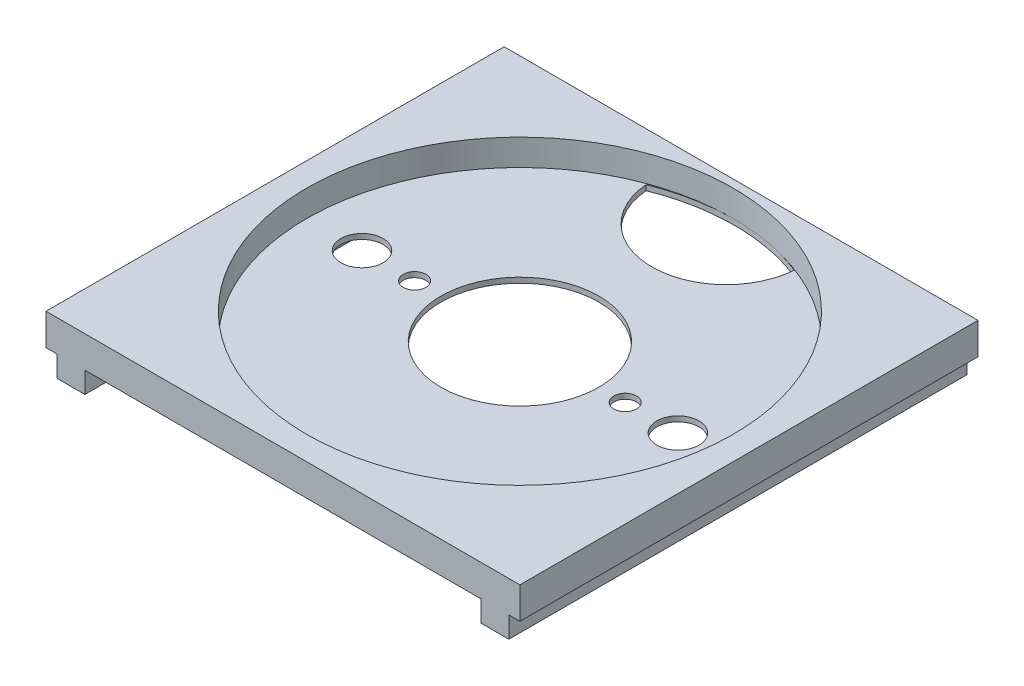
from build123d import *

# Parameters (mm, degrees)
BOSS_EXTRUDE1_DEPTH      = 10
SKETCH2_R                = 40.5
CUT_EXTRUDE1_DEPTH       = 5
SKETCH4_R                = 2.15
CUT_EXTRUDE2_DEPTH       = 2
SKETCH5_R                = 15
CUT_EXTRUDE3_DEPTH       = 64.835726674
CUT_EXTRUDE4_DEPTH       = 66
SKETCH8_W                = 90
SKETCH8_H                = 90
BOSS_EXTRUDE2_DEPTH      = 45
SKETCH9_W                = 70
SKETCH9_H                = 49
CUT_EXTRUDE5_DEPTH       = 68
CUT_EXTRUDE7_DEPTH       = 20
SKETCH12_W               = 0.314102564
SKETCH12_H               = 2.557692307
SKETCH12_H_2             = 3.589743589
SKETCH12_H_3             = 2.557692308
CUT_EXTRUDE9_DEPTH       = 4
CUT_EXTRUDE12_DEPTH      = 3
SKETCH18_R               = 11.15
CUT_EXTRUDE13_DEPTH      = 4.66
SKETCH20_W               = 13.66
SKETCH20_H               = 24.8
CUT_EXTRUDE14_DEPTH      = 14.5
SKETCH22_R               = 1.45
BOSS_EXTRUDE3_DEPTH      = 9
SKETCH24_W               = 13.66
SKETCH24_H               = 24.8
SKETCH24_R               = 1.45
CUT_EXTRUDE16_DEPTH      = 14.5
CUT_EXTRUDE29_DEPTH      = 10
SKETCH32_W               = 5.302834592
SKETCH32_H               = 4.66
CUT_EXTRUDE21_DEPTH      = 10
SKETCH33_R               = 4
CUT_EXTRUDE22_DEPTH      = 10
BOSS_EXTRUDE5_DEPTH      = 10.61
SKETCH45_W               = 13
SKETCH45_H               = 4
BOSS_EXTRUDE6_DEPTH      = 10.61
CUT_EXTRUDE31_DEPTH      = 87
SKETCH49_W               = 90
SKETCH49_H               = 45
CUT_EXTRUDE32_DEPTH      = 108.791465423
SKETCH50_W               = 3
SKETCH50_H               = 10
CUT_EXTRUDE33_DEPTH      = 102.695232452
CUT_EXTRUDE34_DEPTH      = 100.050089959
CUT_EXTRUDE34_DEPTH_BACK = 100.050089959
SKETCH51_W               = 0.1
SKETCH51_H               = 4


with BuildPart() as part:
    # Sketch1 → Boss-Extrude1 (new body)
    with BuildSketch(Plane(origin=(0, 0, 0), x_dir=(1, 0, 0), z_dir=(0, 1, 0))):
        Polygon((0, -45), (-45, -45), (-45, 45), (0, 45), (45, 45), (45, -45), align=None)
    extrude(amount=BOSS_EXTRUDE1_DEPTH)

    # Sketch2 → Cut-Extrude1 (cut)
    with BuildSketch(Plane(origin=(0, 10, 0), x_dir=(1, 0, 0), z_dir=(0, 1, 0))):
        Circle(SKETCH2_R)
    extrude(amount=-CUT_EXTRUDE1_DEPTH, mode=Mode.SUBTRACT)

    # Sketch4 → Cut-Extrude2 (cut)
    with BuildSketch(Plane(origin=(0, 5, 0), x_dir=(1, 0, 0), z_dir=(0, 1, 0))):
        with Locations((-20, 0)):
            Circle(SKETCH4_R)
        with Locations((20, 0)):
            Circle(SKETCH4_R)
    extrude(amount=-CUT_EXTRUDE2_DEPTH, mode=Mode.SUBTRACT)

    # Sketch5 → Cut-Extrude3 (cut, through all)
    with BuildSketch(Plane(origin=(0, 5, 0), x_dir=(1, 0, 0), z_dir=(0, 1, 0))):
        Circle(SKETCH5_R)
    extrude(amount=-CUT_EXTRUDE3_DEPTH, mode=Mode.SUBTRACT)

    # Sketch7 → Cut-Extrude4 (cut)
    with BuildSketch(Plane(origin=(0, 5, 0), x_dir=(1, 0, 0), z_dir=(0, 1, 0))):
        with BuildLine():
            ThreePointArc((-13.841521615, 37.800491998), (0.234545088, 24.817118498), (14.31061179, 37.800491998))
            ThreePointArc((14.31061179, 37.800491998), (0.234545088, 40.503688372), (-13.841521615, 37.800491998))
        make_face()
    extrude(amount=-CUT_EXTRUDE4_DEPTH, mode=Mode.SUBTRACT)

    # Sketch8 → Boss-Extrude2 (add)
    with BuildSketch(Plane.XZ):
        Rectangle(SKETCH8_W, SKETCH8_H)
    extrude(amount=BOSS_EXTRUDE2_DEPTH)

    # Sketch9 → Cut-Extrude5 (cut)
    with BuildSketch(Plane.XY.offset(45)):
        with Locations((0, -20.5)):
            Rectangle(SKETCH9_W, SKETCH9_H)
    extrude(amount=-CUT_EXTRUDE5_DEPTH, mode=Mode.SUBTRACT)

    # Sketch10 → Cut-Extrude7 (cut)
    with BuildSketch(Plane(origin=(0, 0, -45), x_dir=(-1, 0, 0), z_dir=(0, 0, -1))):
        Polygon((-12, -21), (-12, -25), (-18, -25), (-18, -37), (18.337886809, -37), (18.337886809, -25), (12, -25), (12, 1), (-12, 1), (-12, -2), align=None)
    extrude(amount=-CUT_EXTRUDE7_DEPTH, mode=Mode.SUBTRACT)

    # Sketch12 → Cut-Extrude9 (cut)
    # profile 1 of 28: a face of its own
    with BuildSketch(Plane(origin=(0, 0, -45), x_dir=(-1, 0, 0), z_dir=(0, 0, -1))):
        with BuildLine():
            Line((-40.511383242, -5.92052213), (-39.824985005, -5.92052213))
            add(Edge.make_bspline(
                [(-39.824985005, -5.92052213), (-39.777774098, -5.920574027), (-39.687315906, -5.920673462), (-39.55760085, -5.923688208), (-39.439791118, -5.9277149), (-39.334140737, -5.933296793), (-39.240324639, -5.939893384), (-39.15876734, -5.949145423), (-39.088827783, -5.958805719), (-39.046921334, -5.968627125), (-39.027809524, -5.973106265)],
                knots=[0, 0, 0, 0, 1.415646017, 2.712440637, 3.8905458, 4.950247383, 5.884950622, 6.709939814, 7.411656543, 8, 8, 8, 8], degree=3))
            add(Edge.make_bspline(
                [(-39.027809524, -5.973106265), (-39.00361599, -5.979728215), (-38.955799013, -5.992816077), (-38.88689797, -6.0190298), (-38.821344124, -6.050111965), (-38.758912566, -6.085535905), (-38.700370483, -6.126821469), (-38.644844442, -6.172295087), (-38.592824461, -6.223006656), (-38.54460307, -6.278387395), (-38.500318272, -6.337507605), (-38.462188589, -6.401249835), (-38.430261362, -6.468541139), (-38.402878091, -6.53933471), (-38.383169636, -6.614225033), (-38.368322737, -6.692691746), (-38.358899109, -6.774726436), (-38.357996547, -6.830786303), (-38.357537088, -6.859324214)],
                knots=[0, 0, 0, 0, 0.999701418, 1.975846123, 2.934577507, 3.890451536, 4.834027766, 5.787354733, 6.749476667, 7.726910423, 8.712836071, 9.690891519, 10.682875813, 11.679750201, 12.712814741, 13.765529915, 14.8625177, 16, 16, 16, 16], degree=3))
            add(Edge.make_bspline(
                [(-38.357537088, -6.859324214), (-38.357958513, -6.888101991), (-38.358783059, -6.944407655), (-38.368679344, -7.026780443), (-38.382009536, -7.105498833), (-38.402506588, -7.180388283), (-38.429352261, -7.251004054), (-38.460844314, -7.318425286), (-38.498827844, -7.381504958), (-38.542472674, -7.440472075), (-38.591024268, -7.495381988), (-38.644277206, -7.545836782), (-38.702016499, -7.59154112), (-38.764058647, -7.632597464), (-38.831008496, -7.668053744), (-38.901850649, -7.699811049), (-38.977200866, -7.726482109), (-39.02934338, -7.740512171), (-39.055854396, -7.747645528)],
                knots=[0, 0, 0, 0, 1.121902311, 2.195077645, 3.232258892, 4.234102512, 5.217864754, 6.176164875, 7.132989551, 8.084763148, 9.034132444, 9.988522005, 10.94243251, 11.903244335, 12.886203696, 13.894208494, 14.929344452, 16, 16, 16, 16], degree=3))
            add(Edge.make_bspline(
                [(-39.055854396, -7.747645528), (-39.07778173, -7.752308509), (-39.125836757, -7.762527703), (-39.204979479, -7.77393616), (-39.297124865, -7.783673761), (-39.402147145, -7.790974898), (-39.51995205, -7.797225267), (-39.650603307, -7.802193361), (-39.794357384, -7.804923214), (-39.894628628, -7.805064007), (-39.946980197, -7.805137515)],
                knots=[0, 0, 0, 0, 0.601384939, 1.31797006, 2.144135048, 3.087295005, 4.142315834, 5.309527816, 6.595305764, 8, 8, 8, 8], degree=3))
            Line((-39.946980197, -7.805137515), (-40.197280678, -7.805137515))
            Line((-40.197280678, -7.805137515), (-40.197280678, -9.42052213))
            Line((-40.197280678, -9.42052213), (-40.511383242, -9.42052213))
            Line((-40.511383242, -9.42052213), (-40.511383242, -5.92052213))
        make_face()
        with BuildLine():
            Line((-40.197280678, -6.279496489), (-40.197280678, -7.446163156))
            Line((-40.197280678, -7.446163156), (-39.584500229, -7.453875496))
            add(Edge.make_bspline(
                [(-39.584500229, -7.453875496), (-39.554580303, -7.453890959), (-39.496820503, -7.453920812), (-39.41338428, -7.449935588), (-39.335974993, -7.445335055), (-39.264830417, -7.438599132), (-39.199918483, -7.429077875), (-39.141130954, -7.419466137), (-39.088923671, -7.405560774), (-39.027824469, -7.386837705), (-38.959741122, -7.354905089), (-38.885673573, -7.308555199), (-38.822902987, -7.249474491), (-38.76858469, -7.18304666), (-38.725478812, -7.10914753), (-38.69392282, -7.030078593), (-38.675381663, -6.946650744), (-38.672895469, -6.889562605), (-38.671639652, -6.860726457)],
                knots=[0, 0, 0, 0, 1.160613943, 2.240541288, 3.23993089, 4.169200891, 5.011653406, 5.7853311, 6.478053781, 7.106038997, 8.262395093, 9.384106736, 10.481365981, 11.59014053, 12.70357646, 13.786202915, 14.881775077, 16, 16, 16, 16], degree=3))
            add(Edge.make_bspline(
                [(-38.671639652, -6.860726457), (-38.672902299, -6.832587944), (-38.675412283, -6.776652062), (-38.694068147, -6.694673301), (-38.725417461, -6.616437597), (-38.768874055, -6.543464511), (-38.821615185, -6.477275707), (-38.882914528, -6.41977858), (-38.952627789, -6.373556878), (-39.01747602, -6.343723596), (-39.075077206, -6.325508321), (-39.125109166, -6.31276348), (-39.181599841, -6.302587874), (-39.24456762, -6.294348371), (-39.313524454, -6.28729491), (-39.389062769, -6.282508933), (-39.470896412, -6.279707476), (-39.527706983, -6.279568521), (-39.557156479, -6.279496489)],
                knots=[0, 0, 0, 0, 1.120700087, 2.227813068, 3.331159281, 4.466773991, 5.599788987, 6.693661531, 7.80175334, 8.91857717, 9.525282508, 10.207424825, 10.974604443, 11.810962634, 12.737642355, 13.736264703, 14.826523623, 16, 16, 16, 16], degree=3))
            Line((-39.557156479, -6.279496489), (-40.197280678, -6.279496489))
        make_face(mode=Mode.SUBTRACT)
    # profile 2 of 28: a face of its own
    with BuildSketch(Plane(origin=(0, 0, -45), x_dir=(-1, 0, 0), z_dir=(0, 0, -1))):
        with BuildLine():
            Line((-37.819075549, -6.862829823), (-37.504972985, -6.862829823))
            Line((-37.504972985, -6.862829823), (-37.504972985, -7.239332227))
            add(Edge.make_bspline(
                [(-37.504972985, -7.239332227), (-37.481784227, -7.204276398), (-37.437435906, -7.137232399), (-37.363722976, -7.048563098), (-37.288219645, -6.975148051), (-37.210564458, -6.916644533), (-37.130186358, -6.872831414), (-37.048849406, -6.840738379), (-36.965273936, -6.821761064), (-36.909112012, -6.819227405), (-36.880974588, -6.817958028)],
                knots=[0, 0, 0, 0, 1.2804753, 2.448899062, 3.506932113, 4.484331642, 5.4025378, 6.288909075, 7.142734305, 8, 8, 8, 8], degree=3))
            add(Edge.make_bspline(
                [(-36.880974588, -6.817958028), (-36.859148261, -6.819148555), (-36.814239176, -6.82159814), (-36.746256586, -6.838808965), (-36.676213135, -6.866286988), (-36.631070747, -6.89212721), (-36.607537088, -6.905598252)],
                knots=[0, 0, 0, 0, 0.901110191, 1.854092781, 2.881294221, 4, 4, 4, 4], degree=3))
            Line((-36.607537088, -6.905598252), (-36.780013049, -7.177633509))
            add(Edge.make_bspline(
                [(-36.780013049, -7.177633509), (-36.795122071, -7.170893243), (-36.823801885, -7.158098927), (-36.865756451, -7.142956917), (-36.904437788, -7.134041001), (-36.929081346, -7.132690284), (-36.94056994, -7.132060592)],
                knots=[0, 0, 0, 0, 1.180555205, 2.24091978, 3.179933427, 4, 4, 4, 4], degree=3))
            add(Edge.make_bspline(
                [(-36.94056994, -7.132060592), (-36.965775674, -7.133740629), (-37.017188064, -7.137167419), (-37.092672563, -7.164106226), (-37.165919769, -7.207631467), (-37.224091431, -7.255902578), (-37.269133684, -7.302450376), (-37.30127391, -7.343098778), (-37.330756657, -7.38867741), (-37.358926877, -7.438407094), (-37.384593171, -7.49313694), (-37.40854784, -7.552320153), (-37.430206703, -7.616025282), (-37.442556948, -7.660407802), (-37.448883242, -7.683142323)],
                knots=[0, 0, 0, 0, 1.125678352, 2.296057538, 3.5422874, 4.923748041, 5.663163013, 6.437101912, 7.23742474, 8.08941207, 8.991984279, 9.93940061, 10.944477711, 12, 12, 12, 12], degree=3))
            add(Edge.make_bspline(
                [(-37.448883242, -7.683142323), (-37.453615635, -7.703419496), (-37.464097527, -7.748331895), (-37.474289065, -7.82368042), (-37.484358583, -7.912704078), (-37.491455201, -8.015650671), (-37.498033243, -8.132263115), (-37.501743325, -8.262719061), (-37.504846466, -8.407152412), (-37.504929533, -8.508126765), (-37.504972985, -8.56094681)],
                knots=[0, 0, 0, 0, 0.566838948, 1.255505196, 2.06880316, 3.007127437, 4.065329342, 5.249902469, 6.561414163, 8, 8, 8, 8], degree=3))
            Line((-37.504972985, -8.56094681), (-37.504972985, -9.42052213))
            Line((-37.504972985, -9.42052213), (-37.819075549, -9.42052213))
            Line((-37.819075549, -9.42052213), (-37.819075549, -6.862829823))
        make_face()
    # profile 3 of 28: a face of its own
    with BuildSketch(Plane(origin=(0, 0, -45), x_dir=(-1, 0, 0), z_dir=(0, 0, -1))):
        with BuildLine():
            add(Edge.make_bspline(
                [(-35.058057921, -6.817958028), (-35.010066648, -6.818979919), (-34.915967491, -6.820983598), (-34.778159605, -6.842398563), (-34.646614469, -6.875145928), (-34.520828277, -6.92041749), (-34.402411981, -6.98109944), (-34.289640737, -7.053508732), (-34.182823728, -7.139291325), (-34.118800699, -7.205649394), (-34.086303114, -7.239332227)],
                knots=[0, 0, 0, 0, 1.054011418, 2.066658804, 3.057071809, 4.030435133, 4.997543892, 5.974964718, 6.972108034, 8, 8, 8, 8], degree=3))
            add(Edge.make_bspline(
                [(-34.086303114, -7.239332227), (-34.058321159, -7.271546212), (-34.002898779, -7.335350755), (-33.93183306, -7.438806368), (-33.8706115, -7.545946468), (-33.821548539, -7.658193795), (-33.782863516, -7.774568466), (-33.755397819, -7.895470477), (-33.739060884, -8.020632824), (-33.736857918, -8.105636662), (-33.735742216, -8.148687195)],
                knots=[0, 0, 0, 0, 1.025258237, 2.030674902, 3.01204498, 3.988269485, 4.97094183, 5.956517959, 6.965070386, 8, 8, 8, 8], degree=3))
            add(Edge.make_bspline(
                [(-33.735742216, -8.148687195), (-33.736723553, -8.191987252), (-33.738662722, -8.277550186), (-33.757006338, -8.403569551), (-33.785537424, -8.525764374), (-33.826369262, -8.643623068), (-33.878727371, -8.757505895), (-33.942618059, -8.866915445), (-34.018489676, -8.972067578), (-34.104493673, -9.072069416), (-34.199545549, -9.164235631), (-34.302661697, -9.2445639), (-34.411815731, -9.313385425), (-34.528459084, -9.36882184), (-34.651526571, -9.412531541), (-34.781283639, -9.443231557), (-34.91752871, -9.461793241), (-35.010555931, -9.464176814), (-35.058057921, -9.465393925)],
                knots=[0, 0, 0, 0, 0.998656419, 1.973391657, 2.932242238, 3.890759089, 4.846373663, 5.82037756, 6.809684879, 7.83454468, 8.860553229, 9.859544525, 10.845671541, 11.83227036, 12.833544569, 13.85385346, 14.904124723, 16, 16, 16, 16], degree=3))
            add(Edge.make_bspline(
                [(-35.058057921, -9.465393925), (-35.105792641, -9.464172729), (-35.1992835, -9.461780955), (-35.336009482, -9.443303672), (-35.465999101, -9.412545689), (-35.5892277, -9.368678197), (-35.706372547, -9.313383653), (-35.816159044, -9.244771963), (-35.919358959, -9.164211808), (-36.014430944, -9.072075871), (-36.100429549, -8.972065915), (-36.176302557, -8.866915876), (-36.240192884, -8.757505783), (-36.292551087, -8.643623098), (-36.3333829, -8.525764366), (-36.361913993, -8.403569554), (-36.380257608, -8.277550185), (-36.382196776, -8.191987252), (-36.383178114, -8.148687195)],
                knots=[0, 0, 0, 0, 1.099876186, 2.154163076, 3.173186993, 4.173200201, 5.163417411, 6.152872554, 7.150605724, 8.17532212, 9.198891216, 10.186952605, 11.159729845, 12.11414092, 13.071450619, 14.029093627, 15.002601286, 16, 16, 16, 16], degree=3))
            add(Edge.make_bspline(
                [(-36.383178114, -8.148687195), (-36.382054803, -8.105870649), (-36.379830842, -8.021101246), (-36.363510333, -7.896174186), (-36.336151776, -7.775476797), (-36.29742038, -7.659551321), (-36.247905189, -7.547795885), (-36.187543901, -7.440391054), (-36.115753268, -7.337403253), (-36.060551317, -7.273681173), (-36.032617216, -7.241435592)],
                knots=[0, 0, 0, 0, 1.031353054, 2.041901799, 3.029428768, 4.008703097, 4.981709435, 5.96992636, 6.972712378, 8, 8, 8, 8], degree=3))
            add(Edge.make_bspline(
                [(-36.032617216, -7.241435592), (-36.000168625, -7.207460653), (-35.936352761, -7.140642957), (-35.829004034, -7.055110432), (-35.716510212, -6.981194359), (-35.596785286, -6.921718143), (-35.471102428, -6.874879625), (-35.338883186, -6.84231411), (-35.20060767, -6.821060755), (-35.106048049, -6.819002578), (-35.058057921, -6.817958028)],
                knots=[0, 0, 0, 0, 1.027980169, 2.021703884, 2.998553061, 3.971491411, 4.943284454, 5.930300938, 6.949603206, 8, 8, 8, 8], degree=3))
        make_face()
        with BuildLine():
            add(Edge.make_bspline(
                [(-35.059460165, -7.132060592), (-35.093397776, -7.133025184), (-35.160396905, -7.134929466), (-35.25901649, -7.149413371), (-35.353956643, -7.172360875), (-35.445397488, -7.204964931), (-35.53303066, -7.24706383), (-35.616940062, -7.29877219), (-35.697372502, -7.359405147), (-35.772754566, -7.428867818), (-35.841936878, -7.504746813), (-35.902414854, -7.585595172), (-35.953839961, -7.670101518), (-35.99668012, -7.758353729), (-36.028587308, -7.851246143), (-36.05176033, -7.947726774), (-36.066230571, -8.047992191), (-36.068116949, -8.116153209), (-36.069075549, -8.15079056)],
                knots=[0, 0, 0, 0, 1.021534396, 2.016698045, 2.994645724, 3.958388632, 4.93408049, 5.916473867, 6.921342795, 7.962252576, 8.998418191, 10.008913653, 10.997312074, 11.973003931, 12.956656626, 13.948281152, 14.957379055, 16, 16, 16, 16], degree=3))
            add(Edge.make_bspline(
                [(-36.069075549, -8.15079056), (-36.067468726, -8.195542587), (-36.064279481, -8.284366993), (-36.038344245, -8.415178115), (-35.994957965, -8.540759967), (-35.936370685, -8.660376353), (-35.862964467, -8.771048631), (-35.7764774, -8.869720116), (-35.6778377, -8.954905927), (-35.568221199, -9.025586773), (-35.449866882, -9.081746529), (-35.32461056, -9.121545504), (-35.193969866, -9.147417197), (-35.104689135, -9.149988671), (-35.059460165, -9.151291361)],
                knots=[0, 0, 0, 0, 1.016792936, 2.018143844, 3.017858371, 4.030088057, 5.03801393, 6.028138512, 7.003788237, 7.991172063, 8.984598303, 9.972568034, 10.972917682, 12, 12, 12, 12], degree=3))
            add(Edge.make_bspline(
                [(-35.059460165, -9.151291361), (-35.014233796, -9.149981081), (-34.9249582, -9.147394624), (-34.794499023, -9.121675804), (-34.669585051, -9.081572144), (-34.551353664, -9.025649934), (-34.44178706, -8.954637519), (-34.342437939, -8.870201142), (-34.256689328, -8.770787291), (-34.183355723, -8.660229762), (-34.12380898, -8.54094541), (-34.080625778, -8.415154937), (-34.054628193, -8.284372895), (-34.051447364, -8.195544565), (-34.04984478, -8.15079056)],
                knots=[0, 0, 0, 0, 1.02726834, 2.027799167, 3.010890988, 4.004497153, 4.992059811, 5.971914811, 6.958719428, 7.966827853, 8.981595046, 9.981490638, 10.983022906, 12, 12, 12, 12], degree=3))
            add(Edge.make_bspline(
                [(-34.04984478, -8.15079056), (-34.05080305, -8.116153002), (-34.052688779, -8.047991577), (-34.067163744, -7.947729123), (-34.090319283, -7.851237526), (-34.122290901, -7.758385523), (-34.164944915, -7.669873019), (-34.217361708, -7.585843292), (-34.277592733, -7.504466746), (-34.347609854, -7.429113105), (-34.422913232, -7.359378068), (-34.50337827, -7.298748679), (-34.587163249, -7.247291083), (-34.674541831, -7.204604843), (-34.765994399, -7.172657503), (-34.860801528, -7.149280871), (-34.959000338, -7.134990674), (-35.025759381, -7.133043533), (-35.059460165, -7.132060592)],
                knots=[0, 0, 0, 0, 1.042956736, 2.052379634, 3.044323526, 4.02829302, 5.004299113, 5.996692471, 7.007513377, 8.048758398, 9.090003419, 10.095195979, 11.07790575, 12.047570684, 13.018257071, 13.989683339, 14.985167495, 16, 16, 16, 16], degree=3))
        make_face(mode=Mode.SUBTRACT)
    # profile 4 of 28: a face of its own
    with BuildSketch(Plane(origin=(0, 0, -45), x_dir=(-1, 0, 0), z_dir=(0, 0, -1))):
        Polygon((-32.793434524, -5.830778541), (-32.47933196, -5.830778541), (-32.47933196, -6.862829823), (-32.030614011, -6.862829823), (-32.030614011, -7.176932387), (-32.47933196, -7.176932387), (-32.47933196, -9.42052213), (-32.793434524, -9.42052213), (-32.793434524, -7.176932387), (-33.242152473, -7.176932387), (-33.242152473, -6.862829823), (-32.793434524, -6.862829823), align=None)
    # profile 5 of 28: a face of its own
    with BuildSketch(Plane(origin=(0, 0, -45), x_dir=(-1, 0, 0), z_dir=(0, 0, -1))):
        with BuildLine():
            add(Edge.make_bspline(
                [(-30.25677587, -6.817958028), (-30.208784597, -6.818979919), (-30.11468544, -6.820983598), (-29.976877554, -6.842398563), (-29.845332418, -6.875145928), (-29.719546226, -6.92041749), (-29.60112993, -6.98109944), (-29.488358686, -7.053508732), (-29.381541677, -7.139291325), (-29.317518648, -7.205649394), (-29.285021062, -7.239332227)],
                knots=[0, 0, 0, 0, 1.054011418, 2.066658804, 3.057071809, 4.030435133, 4.997543892, 5.974964718, 6.972108034, 8, 8, 8, 8], degree=3))
            add(Edge.make_bspline(
                [(-29.285021062, -7.239332227), (-29.257039108, -7.271546212), (-29.201616728, -7.335350755), (-29.130551009, -7.438806368), (-29.069329449, -7.545946468), (-29.020266488, -7.658193795), (-28.981581464, -7.774568466), (-28.954115768, -7.895470477), (-28.937778833, -8.020632824), (-28.935575866, -8.105636662), (-28.934460165, -8.148687195)],
                knots=[0, 0, 0, 0, 1.025258237, 2.030674902, 3.01204498, 3.988269485, 4.97094183, 5.956517959, 6.965070386, 8, 8, 8, 8], degree=3))
            add(Edge.make_bspline(
                [(-28.934460165, -8.148687195), (-28.935441502, -8.191987252), (-28.93738067, -8.277550186), (-28.955724287, -8.403569551), (-28.984255373, -8.525764374), (-29.025087211, -8.643623068), (-29.07744532, -8.757505895), (-29.141336008, -8.866915445), (-29.217207625, -8.972067578), (-29.303211622, -9.072069416), (-29.398263498, -9.164235631), (-29.501379646, -9.2445639), (-29.61053368, -9.313385425), (-29.727177033, -9.36882184), (-29.85024452, -9.412531541), (-29.980001588, -9.443231557), (-30.116246658, -9.461793241), (-30.20927388, -9.464176814), (-30.25677587, -9.465393925)],
                knots=[0, 0, 0, 0, 0.998656419, 1.973391657, 2.932242238, 3.890759089, 4.846373663, 5.82037756, 6.809684879, 7.83454468, 8.860553229, 9.859544525, 10.845671541, 11.83227036, 12.833544569, 13.85385346, 14.904124723, 16, 16, 16, 16], degree=3))
            add(Edge.make_bspline(
                [(-30.25677587, -9.465393925), (-30.304510589, -9.464172729), (-30.398001449, -9.461780955), (-30.534727431, -9.443303672), (-30.66471705, -9.412545689), (-30.787945649, -9.368678197), (-30.905090496, -9.313383653), (-31.014876992, -9.244771963), (-31.118076908, -9.164211808), (-31.213148892, -9.072075871), (-31.299147498, -8.972065915), (-31.375020506, -8.866915876), (-31.438910832, -8.757505783), (-31.491269036, -8.643623098), (-31.532100849, -8.525764366), (-31.560631942, -8.403569554), (-31.578975556, -8.277550185), (-31.580914725, -8.191987252), (-31.581896062, -8.148687195)],
                knots=[0, 0, 0, 0, 1.099876186, 2.154163076, 3.173186993, 4.173200201, 5.163417411, 6.152872554, 7.150605724, 8.17532212, 9.198891216, 10.186952605, 11.159729845, 12.11414092, 13.071450619, 14.029093627, 15.002601286, 16, 16, 16, 16], degree=3))
            add(Edge.make_bspline(
                [(-31.581896062, -8.148687195), (-31.580772752, -8.105870649), (-31.57854879, -8.021101246), (-31.562228281, -7.896174186), (-31.534869725, -7.775476797), (-31.496138328, -7.659551321), (-31.446623138, -7.547795885), (-31.38626185, -7.440391054), (-31.314471217, -7.337403253), (-31.259269266, -7.273681173), (-31.231335165, -7.241435592)],
                knots=[0, 0, 0, 0, 1.031353054, 2.041901799, 3.029428768, 4.008703097, 4.981709435, 5.96992636, 6.972712378, 8, 8, 8, 8], degree=3))
            add(Edge.make_bspline(
                [(-31.231335165, -7.241435592), (-31.198886574, -7.207460653), (-31.13507071, -7.140642957), (-31.027721982, -7.055110432), (-30.915228161, -6.981194359), (-30.795503235, -6.921718143), (-30.669820377, -6.874879625), (-30.537601135, -6.84231411), (-30.399325619, -6.821060755), (-30.304765998, -6.819002578), (-30.25677587, -6.817958028)],
                knots=[0, 0, 0, 0, 1.027980169, 2.021703884, 2.998553061, 3.971491411, 4.943284454, 5.930300938, 6.949603206, 8, 8, 8, 8], degree=3))
        make_face()
        with BuildLine():
            add(Edge.make_bspline(
                [(-30.258178114, -7.132060592), (-30.292115725, -7.133025184), (-30.359114854, -7.134929466), (-30.457734438, -7.149413371), (-30.552674592, -7.172360875), (-30.644115436, -7.204964931), (-30.731748609, -7.24706383), (-30.815658011, -7.29877219), (-30.896090451, -7.359405147), (-30.971472514, -7.428867818), (-31.040654827, -7.504746813), (-31.101132803, -7.585595172), (-31.15255791, -7.670101518), (-31.195398068, -7.758353729), (-31.227305257, -7.851246143), (-31.250478279, -7.947726774), (-31.26494852, -8.047992191), (-31.266834898, -8.116153209), (-31.267793498, -8.15079056)],
                knots=[0, 0, 0, 0, 1.021534396, 2.016698045, 2.994645724, 3.958388632, 4.93408049, 5.916473867, 6.921342795, 7.962252576, 8.998418191, 10.008913653, 10.997312074, 11.973003931, 12.956656626, 13.948281152, 14.957379055, 16, 16, 16, 16], degree=3))
            add(Edge.make_bspline(
                [(-31.267793498, -8.15079056), (-31.266186675, -8.195542587), (-31.26299743, -8.284366993), (-31.237062194, -8.415178115), (-31.193675914, -8.540759967), (-31.135088634, -8.660376353), (-31.061682415, -8.771048631), (-30.975195349, -8.869720116), (-30.876555648, -8.954905927), (-30.766939148, -9.025586773), (-30.64858483, -9.081746529), (-30.523328509, -9.121545504), (-30.392687815, -9.147417197), (-30.303407084, -9.149988671), (-30.258178114, -9.151291361)],
                knots=[0, 0, 0, 0, 1.016792936, 2.018143844, 3.017858371, 4.030088057, 5.03801393, 6.028138512, 7.003788237, 7.991172063, 8.984598303, 9.972568034, 10.972917682, 12, 12, 12, 12], degree=3))
            add(Edge.make_bspline(
                [(-30.258178114, -9.151291361), (-30.212951745, -9.149981081), (-30.123676149, -9.147394624), (-29.993216972, -9.121675804), (-29.868303, -9.081572144), (-29.750071612, -9.025649934), (-29.640505009, -8.954637519), (-29.541155888, -8.870201142), (-29.455407277, -8.770787291), (-29.382073672, -8.660229762), (-29.322526929, -8.54094541), (-29.279343727, -8.415154937), (-29.253346141, -8.284372895), (-29.250165313, -8.195544565), (-29.248562729, -8.15079056)],
                knots=[0, 0, 0, 0, 1.02726834, 2.027799167, 3.010890988, 4.004497153, 4.992059811, 5.971914811, 6.958719428, 7.966827853, 8.981595046, 9.981490638, 10.983022906, 12, 12, 12, 12], degree=3))
            add(Edge.make_bspline(
                [(-29.248562729, -8.15079056), (-29.249520999, -8.116153002), (-29.251406728, -8.047991577), (-29.265881692, -7.947729123), (-29.289037232, -7.851237526), (-29.321008849, -7.758385523), (-29.363662863, -7.669873019), (-29.416079656, -7.585843292), (-29.476310682, -7.504466746), (-29.546327803, -7.429113105), (-29.621631181, -7.359378068), (-29.702096219, -7.298748679), (-29.785881197, -7.247291083), (-29.87325978, -7.204604843), (-29.964712348, -7.172657503), (-30.059519477, -7.149280871), (-30.157718287, -7.134990674), (-30.22447733, -7.133043533), (-30.258178114, -7.132060592)],
                knots=[0, 0, 0, 0, 1.042956736, 2.052379634, 3.044323526, 4.02829302, 5.004299113, 5.996692471, 7.007513377, 8.048758398, 9.090003419, 10.095195979, 11.07790575, 12.047570684, 13.018257071, 13.989683339, 14.985167495, 16, 16, 16, 16], degree=3))
        make_face(mode=Mode.SUBTRACT)
    # profile 6 of 28: a face of its own
    with BuildSketch(Plane(origin=(0, 0, -45), x_dir=(-1, 0, 0), z_dir=(0, 0, -1))):
        with BuildLine():
            Line((-28.216511447, -5.92052213), (-27.53011321, -5.92052213))
            add(Edge.make_bspline(
                [(-27.53011321, -5.92052213), (-27.482902304, -5.920574027), (-27.392444111, -5.920673462), (-27.262729055, -5.923688208), (-27.144919323, -5.9277149), (-27.039268942, -5.933296793), (-26.945452844, -5.939893384), (-26.863895545, -5.949145423), (-26.793955989, -5.958805719), (-26.752049539, -5.968627125), (-26.732937729, -5.973106265)],
                knots=[0, 0, 0, 0, 1.415646017, 2.712440637, 3.8905458, 4.950247383, 5.884950622, 6.709939814, 7.411656543, 8, 8, 8, 8], degree=3))
            add(Edge.make_bspline(
                [(-26.732937729, -5.973106265), (-26.708744195, -5.979728215), (-26.660927218, -5.992816077), (-26.592026175, -6.0190298), (-26.526472329, -6.050111965), (-26.464040771, -6.085535905), (-26.405498688, -6.126821469), (-26.349972647, -6.172295087), (-26.297952667, -6.223006656), (-26.249731275, -6.278387395), (-26.205446477, -6.337507605), (-26.167316794, -6.401249835), (-26.135389567, -6.468541139), (-26.108006296, -6.53933471), (-26.088297841, -6.614225033), (-26.073450942, -6.692691746), (-26.064027314, -6.774726436), (-26.063124752, -6.830786303), (-26.062665293, -6.859324214)],
                knots=[0, 0, 0, 0, 0.999701418, 1.975846123, 2.934577507, 3.890451536, 4.834027766, 5.787354733, 6.749476667, 7.726910423, 8.712836071, 9.690891519, 10.682875813, 11.679750201, 12.712814741, 13.765529915, 14.8625177, 16, 16, 16, 16], degree=3))
            add(Edge.make_bspline(
                [(-26.062665293, -6.859324214), (-26.063086718, -6.888101991), (-26.063911264, -6.944407655), (-26.073807549, -7.026780443), (-26.087137741, -7.105498833), (-26.107634793, -7.180388283), (-26.134480466, -7.251004054), (-26.165972519, -7.318425286), (-26.203956049, -7.381504958), (-26.247600879, -7.440472075), (-26.296152473, -7.495381988), (-26.349405412, -7.545836782), (-26.407144704, -7.59154112), (-26.469186852, -7.632597464), (-26.536136701, -7.668053744), (-26.606978855, -7.699811049), (-26.682329071, -7.726482109), (-26.734471585, -7.740512171), (-26.760982601, -7.747645528)],
                knots=[0, 0, 0, 0, 1.121902311, 2.195077645, 3.232258892, 4.234102512, 5.217864754, 6.176164875, 7.132989551, 8.084763148, 9.034132444, 9.988522005, 10.94243251, 11.903244335, 12.886203696, 13.894208494, 14.929344452, 16, 16, 16, 16], degree=3))
            add(Edge.make_bspline(
                [(-26.760982601, -7.747645528), (-26.782909935, -7.752308509), (-26.830964962, -7.762527703), (-26.910107684, -7.77393616), (-27.00225307, -7.783673761), (-27.10727535, -7.790974898), (-27.225080255, -7.797225267), (-27.355731512, -7.802193361), (-27.49948559, -7.804923214), (-27.599756834, -7.805064007), (-27.652108402, -7.805137515)],
                knots=[0, 0, 0, 0, 0.601384939, 1.31797006, 2.144135048, 3.087295005, 4.142315834, 5.309527816, 6.595305764, 8, 8, 8, 8], degree=3))
            Line((-27.652108402, -7.805137515), (-27.902408883, -7.805137515))
            Line((-27.902408883, -7.805137515), (-27.902408883, -9.42052213))
            Line((-27.902408883, -9.42052213), (-28.216511447, -9.42052213))
            Line((-28.216511447, -9.42052213), (-28.216511447, -5.92052213))
        make_face()
        with BuildLine():
            Line((-27.902408883, -6.279496489), (-27.902408883, -7.446163156))
            Line((-27.902408883, -7.446163156), (-27.289628434, -7.453875496))
            add(Edge.make_bspline(
                [(-27.289628434, -7.453875496), (-27.259708508, -7.453890959), (-27.201948708, -7.453920812), (-27.118512485, -7.449935588), (-27.041103198, -7.445335055), (-26.969958622, -7.438599132), (-26.905046688, -7.429077875), (-26.846259159, -7.419466137), (-26.794051876, -7.405560774), (-26.732952674, -7.386837705), (-26.664869327, -7.354905089), (-26.590801778, -7.308555199), (-26.528031192, -7.249474491), (-26.473712895, -7.18304666), (-26.430607017, -7.10914753), (-26.399051025, -7.030078593), (-26.380509868, -6.946650744), (-26.378023674, -6.889562605), (-26.376767857, -6.860726457)],
                knots=[0, 0, 0, 0, 1.160613943, 2.240541288, 3.23993089, 4.169200891, 5.011653406, 5.7853311, 6.478053781, 7.106038997, 8.262395093, 9.384106736, 10.481365981, 11.59014053, 12.70357646, 13.786202915, 14.881775077, 16, 16, 16, 16], degree=3))
            add(Edge.make_bspline(
                [(-26.376767857, -6.860726457), (-26.378030504, -6.832587944), (-26.380540489, -6.776652062), (-26.399196352, -6.694673301), (-26.430545666, -6.616437597), (-26.47400226, -6.543464511), (-26.52674339, -6.477275707), (-26.588042733, -6.41977858), (-26.657755995, -6.373556878), (-26.722604226, -6.343723596), (-26.780205412, -6.325508321), (-26.830237371, -6.31276348), (-26.886728046, -6.302587874), (-26.949695825, -6.294348371), (-27.018652659, -6.28729491), (-27.094190974, -6.282508933), (-27.176024618, -6.279707476), (-27.232835188, -6.279568521), (-27.262284684, -6.279496489)],
                knots=[0, 0, 0, 0, 1.120700087, 2.227813068, 3.331159281, 4.466773991, 5.599788987, 6.693661531, 7.80175334, 8.91857717, 9.525282508, 10.207424825, 10.974604443, 11.810962634, 12.737642355, 13.736264703, 14.826523623, 16, 16, 16, 16], degree=3))
            Line((-27.262284684, -6.279496489), (-27.902408883, -6.279496489))
        make_face(mode=Mode.SUBTRACT)
    # profile 7 of 28: a face of its own
    with BuildSketch(Plane(origin=(0, 0, -45), x_dir=(-1, 0, 0), z_dir=(0, 0, -1))):
        with BuildLine():
            add(Edge.make_bspline(
                [(-25.323682921, -5.785906746), (-25.304191605, -5.786810898), (-25.266023866, -5.788581402), (-25.210830598, -5.803742879), (-25.160573586, -5.829442565), (-25.115995853, -5.863922246), (-25.077743966, -5.904471689), (-25.050963256, -5.951732657), (-25.03375086, -6.002791296), (-25.031672305, -6.038406385), (-25.030614011, -6.056539759)],
                knots=[0, 0, 0, 0, 1.055194115, 2.066272739, 3.074728998, 4.095836921, 5.109056067, 6.073838105, 7.019297344, 8, 8, 8, 8], degree=3))
            add(Edge.make_bspline(
                [(-25.030614011, -6.056539759), (-25.031696171, -6.074202412), (-25.033835473, -6.109119387), (-25.050949961, -6.159292859), (-25.077972199, -6.205897142), (-25.115971324, -6.246367853), (-25.160580085, -6.280828473), (-25.210828871, -6.306533212), (-25.26602432, -6.321693349), (-25.304191759, -6.323464038), (-25.323682921, -6.324368284)],
                knots=[0, 0, 0, 0, 0.96129708, 1.900370562, 2.859976407, 3.87933698, 4.906634145, 5.921202961, 6.938410037, 8, 8, 8, 8], degree=3))
            add(Edge.make_bspline(
                [(-25.323682921, -6.324368284), (-25.342951196, -6.323498564), (-25.380454377, -6.321805767), (-25.434821219, -6.30623575), (-25.484649708, -6.280819676), (-25.529314381, -6.246593491), (-25.566544574, -6.205648594), (-25.5936429, -6.1593213), (-25.610717861, -6.109112146), (-25.61286249, -6.074199979), (-25.613947344, -6.056539759)],
                knots=[0, 0, 0, 0, 1.054934014, 2.053291228, 3.073705704, 4.106921865, 5.123545215, 6.088680038, 7.033164197, 8, 8, 8, 8], degree=3))
            add(Edge.make_bspline(
                [(-25.613947344, -6.056539759), (-25.612886258, -6.038408909), (-25.610802217, -6.002798776), (-25.593630101, -5.951703744), (-25.566770293, -5.904722242), (-25.529289729, -5.863696742), (-25.484656269, -5.829451308), (-25.434819524, -5.804040326), (-25.380454824, -5.788468987), (-25.342951348, -5.786776372), (-25.323682921, -5.785906746)],
                knots=[0, 0, 0, 0, 0.98631895, 1.937192651, 2.907499808, 3.917963147, 4.944918757, 5.95915025, 6.951458133, 8, 8, 8, 8], degree=3))
        make_face()
    # profile 8 of 28: a face of its own
    with BuildSketch(Plane(origin=(0, 0, -45), x_dir=(-1, 0, 0), z_dir=(0, 0, -1))):
        with Locations((-25.322280678, -8.141675977)):
            Rectangle(SKETCH12_W, SKETCH12_H)
    # profile 9 of 28: a face of its own
    with BuildSketch(Plane(origin=(0, 0, -45), x_dir=(-1, 0, 0), z_dir=(0, 0, -1))):
        with Locations((-24.290229396, -7.625650335)):
            Rectangle(SKETCH12_W, SKETCH12_H_2)
    # profile 10 of 28: a face of its own
    with BuildSketch(Plane(origin=(0, 0, -45), x_dir=(-1, 0, 0), z_dir=(0, 0, -1))):
        with Locations((-23.303049908, -7.625650335)):
            Rectangle(SKETCH12_W, SKETCH12_H_2)
    # profile 11 of 28: a face of its own
    with BuildSketch(Plane(origin=(0, 0, -45), x_dir=(-1, 0, 0), z_dir=(0, 0, -1))):
        with BuildLine():
            Line((-40.511383242, -16.253855464), (-40.511383242, -12.753855464))
            Line((-40.511383242, -12.753855464), (-39.804652473, -12.753855464))
            add(Edge.make_bspline(
                [(-39.804652473, -12.753855464), (-39.743183484, -12.754298034), (-39.624425719, -12.755153077), (-39.452813272, -12.760574468), (-39.294029509, -12.770164934), (-39.14859665, -12.78413446), (-39.016115438, -12.801287493), (-38.89695683, -12.822787898), (-38.790504687, -12.848176068), (-38.725035246, -12.869821518), (-38.694075549, -12.880057387)],
                knots=[0, 0, 0, 0, 1.314313732, 2.53924729, 3.670748893, 4.714932338, 5.66265055, 6.526160246, 7.303039223, 8, 8, 8, 8], degree=3))
            add(Edge.make_bspline(
                [(-38.694075549, -12.880057387), (-38.65358081, -12.895488093), (-38.573509618, -12.925999587), (-38.459502495, -12.983555888), (-38.352177132, -13.04876899), (-38.250957987, -13.121724852), (-38.158157161, -13.204489201), (-38.070149264, -13.293546286), (-37.990534541, -13.392134627), (-37.917626244, -13.498209615), (-37.851890585, -13.610521667), (-37.794751427, -13.728856776), (-37.747297434, -13.852613984), (-37.707904207, -13.981449132), (-37.67685775, -14.115645509), (-37.655675818, -14.255359376), (-37.641704828, -14.400038565), (-37.640300777, -14.498213029), (-37.63958837, -14.548026137)],
                knots=[0, 0, 0, 0, 0.984719456, 1.947108742, 2.898477687, 3.838006223, 4.779231079, 5.722358779, 6.681677486, 7.655904652, 8.64651281, 9.637519902, 10.640069247, 11.656948941, 12.698408672, 13.768548281, 14.867775369, 16, 16, 16, 16], degree=3))
            add(Edge.make_bspline(
                [(-37.63958837, -14.548026137), (-37.640217337, -14.591287375), (-37.641456784, -14.676538164), (-37.652586099, -14.80217906), (-37.668762419, -14.924092631), (-37.693806617, -15.041698331), (-37.724209131, -15.156026549), (-37.763173282, -15.265858794), (-37.807808778, -15.372202603), (-37.859858657, -15.473620079), (-37.917000042, -15.569703451), (-37.978321785, -15.660278979), (-38.04375848, -15.744054201), (-38.113934113, -15.821282813), (-38.18794183, -15.891848391), (-38.26626616, -15.956340407), (-38.349109211, -16.013496962), (-38.436099934, -16.06556407), (-38.529776063, -16.110984425), (-38.631911929, -16.149414435), (-38.742943107, -16.181261051), (-38.862597064, -16.207831946), (-38.991080542, -16.228909249), (-39.128519508, -16.243035641), (-39.274702797, -16.252588574), (-39.375082063, -16.253424968), (-39.426747825, -16.253855464)],
                knots=[0, 0, 0, 0, 1.105936401, 2.179363191, 3.223086493, 4.248585256, 5.251745608, 6.245858792, 7.225916811, 8.198733463, 9.158002045, 10.082870192, 10.993790845, 11.873723703, 12.748670949, 13.606408763, 14.465103618, 15.319838547, 16.196477973, 17.123216899, 18.106603292, 19.147568657, 20.255746949, 21.433717677, 22.679120308, 24, 24, 24, 24], degree=3))
            Line((-39.426747825, -16.253855464), (-40.511383242, -16.253855464))
        make_face()
        with BuildLine():
            Line((-40.197280678, -15.894881105), (-39.795537889, -15.894881105))
            add(Edge.make_bspline(
                [(-39.795537889, -15.894881105), (-39.737809518, -15.894633008), (-39.62677672, -15.894155828), (-39.467118723, -15.889968625), (-39.321239326, -15.883126688), (-39.189117817, -15.87355161), (-39.070828793, -15.860882995), (-38.966125043, -15.846758092), (-38.875349784, -15.829160641), (-38.820420347, -15.813209682), (-38.795037088, -15.805838637)],
                knots=[0, 0, 0, 0, 1.375205317, 2.645023457, 3.804390687, 4.853969522, 5.800190428, 6.637939096, 7.370582563, 8, 8, 8, 8], degree=3))
            add(Edge.make_bspline(
                [(-38.795037088, -15.805838637), (-38.763088726, -15.794587079), (-38.699955088, -15.772352705), (-38.609074002, -15.731795044), (-38.524316998, -15.683752974), (-38.444206973, -15.6303507), (-38.369880317, -15.569704698), (-38.300456201, -15.50313371), (-38.236074399, -15.430298935), (-38.177400091, -15.351290773), (-38.124891787, -15.266600977), (-38.079420558, -15.177062144), (-38.039569026, -15.083655333), (-38.008290434, -14.984946175), (-37.98377485, -14.881817116), (-37.966410162, -14.774260903), (-37.955595437, -14.662297621), (-37.954333989, -14.586145497), (-37.953690934, -14.547325015)],
                knots=[0, 0, 0, 0, 0.998632004, 1.973411704, 2.929992603, 3.868527914, 4.809262121, 5.754881198, 6.702106254, 7.672490631, 8.653608572, 9.636854334, 10.631411391, 11.644891563, 12.686317036, 13.754757253, 14.855430412, 16, 16, 16, 16], degree=3))
            add(Edge.make_bspline(
                [(-37.953690934, -14.547325015), (-37.954204221, -14.506391535), (-37.955212579, -14.42597735), (-37.967886889, -14.307986655), (-37.986408445, -14.194506005), (-38.013192131, -14.085527809), (-38.04732301, -13.980839457), (-38.089917652, -13.881019947), (-38.138584271, -13.785015078), (-38.196487608, -13.695040712), (-38.259903201, -13.609947603), (-38.33028108, -13.531992688), (-38.406503119, -13.460998387), (-38.487737968, -13.395859075), (-38.576275068, -13.339195399), (-38.670028758, -13.288508718), (-38.77037443, -13.245492826), (-38.840187125, -13.222613964), (-38.875666094, -13.210986874)],
                knots=[0, 0, 0, 0, 1.122418816, 2.205001699, 3.251619955, 4.274784885, 5.280384055, 6.268708349, 7.249350384, 8.229342522, 9.199999885, 10.157847722, 11.105861043, 12.055065948, 13.010012805, 13.98527497, 14.976112212, 16, 16, 16, 16], degree=3))
            add(Edge.make_bspline(
                [(-38.875666094, -13.210986874), (-38.905017241, -13.202870446), (-38.967425831, -13.185612694), (-39.069265295, -13.166787321), (-39.183880444, -13.150182822), (-39.311780146, -13.136124783), (-39.452818605, -13.126037461), (-39.607104293, -13.118466147), (-39.774703897, -13.113359514), (-39.890886431, -13.113010807), (-39.951186928, -13.112829823)],
                knots=[0, 0, 0, 0, 0.674548936, 1.434276114, 2.292660221, 3.240891867, 4.284742987, 5.42552168, 6.663806718, 8, 8, 8, 8], degree=3))
            Line((-39.951186928, -13.112829823), (-40.197280678, -13.112829823))
            Line((-40.197280678, -13.112829823), (-40.197280678, -15.894881105))
        make_face(mode=Mode.SUBTRACT)
    # profile 12 of 28: a face of its own
    with BuildSketch(Plane(origin=(0, 0, -45), x_dir=(-1, 0, 0), z_dir=(0, 0, -1))):
        with BuildLine():
            add(Edge.make_bspline(
                [(-36.900605998, -12.619240079), (-36.881114682, -12.620144232), (-36.842946943, -12.621914736), (-36.787753675, -12.637076213), (-36.737496663, -12.662775898), (-36.69291893, -12.697255579), (-36.654667043, -12.737805023), (-36.627886333, -12.785065991), (-36.610673937, -12.83612463), (-36.608595381, -12.871739719), (-36.607537088, -12.889873092)],
                knots=[0, 0, 0, 0, 1.055194115, 2.066272739, 3.074728998, 4.095836921, 5.109056067, 6.073838105, 7.019297344, 8, 8, 8, 8], degree=3))
            add(Edge.make_bspline(
                [(-36.607537088, -12.889873092), (-36.608619248, -12.907535745), (-36.61075855, -12.94245272), (-36.627873038, -12.992626192), (-36.654895276, -13.039230476), (-36.692894401, -13.079701186), (-36.737503162, -13.114161806), (-36.787751948, -13.139866545), (-36.842947397, -13.155026682), (-36.881114836, -13.156797371), (-36.900605998, -13.157701618)],
                knots=[0, 0, 0, 0, 0.96129708, 1.900370562, 2.859976407, 3.87933698, 4.906634145, 5.921202961, 6.938410037, 8, 8, 8, 8], degree=3))
            add(Edge.make_bspline(
                [(-36.900605998, -13.157701618), (-36.919874273, -13.156831897), (-36.957377454, -13.155139101), (-37.011744296, -13.139569083), (-37.061572785, -13.11415301), (-37.106237458, -13.079926825), (-37.143467651, -13.038981927), (-37.170565976, -12.992654634), (-37.187640938, -12.942445479), (-37.189785567, -12.907533313), (-37.190870421, -12.889873092)],
                knots=[0, 0, 0, 0, 1.054934014, 2.053291228, 3.073705704, 4.106921865, 5.123545215, 6.088680038, 7.033164197, 8, 8, 8, 8], degree=3))
            add(Edge.make_bspline(
                [(-37.190870421, -12.889873092), (-37.189809335, -12.871742242), (-37.187725294, -12.83613211), (-37.170553177, -12.785037077), (-37.14369337, -12.738055575), (-37.106212806, -12.697030076), (-37.061579346, -12.662784641), (-37.011742601, -12.637373659), (-36.957377901, -12.62180232), (-36.919874425, -12.620109706), (-36.900605998, -12.619240079)],
                knots=[0, 0, 0, 0, 0.98631895, 1.937192651, 2.907499808, 3.917963147, 4.944918757, 5.95915025, 6.951458133, 8, 8, 8, 8], degree=3))
        make_face()
    # profile 13 of 28: a face of its own
    with BuildSketch(Plane(origin=(0, 0, -45), x_dir=(-1, 0, 0), z_dir=(0, 0, -1))):
        with Locations((-36.899203755, -14.97500931)):
            Rectangle(SKETCH12_W, SKETCH12_H_3)
    # profile 14 of 28: a face of its own
    with BuildSketch(Plane(origin=(0, 0, -45), x_dir=(-1, 0, 0), z_dir=(0, 0, -1))):
        with BuildLine():
            Line((-34.767793498, -14.015173573), (-34.980934524, -14.234624695))
            add(Edge.make_bspline(
                [(-34.980934524, -14.234624695), (-34.999325027, -14.213311548), (-35.034779753, -14.172222311), (-35.091011234, -14.117285245), (-35.147034838, -14.071148306), (-35.202083651, -14.032196047), (-35.25754192, -14.0027469), (-35.312758838, -13.981252038), (-35.367791577, -13.967950233), (-35.404577612, -13.966235794), (-35.422641255, -13.965393925)],
                knots=[0, 0, 0, 0, 1.26578478, 2.440284043, 3.530471711, 4.527705817, 5.468200915, 6.346673037, 7.188140097, 8, 8, 8, 8], degree=3))
            add(Edge.make_bspline(
                [(-35.422641255, -13.965393925), (-35.444780644, -13.966468798), (-35.48834783, -13.968583996), (-35.550773649, -13.989697427), (-35.608724274, -14.022106165), (-35.658881254, -14.068074749), (-35.701368934, -14.120839017), (-35.732382615, -14.179835342), (-35.751348598, -14.243283386), (-35.75375333, -14.287313244), (-35.754972985, -14.309644727)],
                knots=[0, 0, 0, 0, 0.99966794, 1.967205029, 2.953328237, 3.988086729, 5.028030931, 6.008226631, 6.989793394, 8, 8, 8, 8], degree=3))
            add(Edge.make_bspline(
                [(-35.754972985, -14.309644727), (-35.753862173, -14.329856771), (-35.75164368, -14.370223882), (-35.734397001, -14.429771915), (-35.706930929, -14.487828954), (-35.681260734, -14.52339186), (-35.668033883, -14.541716041)],
                knots=[0, 0, 0, 0, 0.960159726, 1.917612774, 2.927026955, 4, 4, 4, 4], degree=3))
            add(Edge.make_bspline(
                [(-35.668033883, -14.541716041), (-35.660070389, -14.551500625), (-35.643121096, -14.57232588), (-35.611312581, -14.601229733), (-35.575290078, -14.633171984), (-35.531970141, -14.665108821), (-35.483219113, -14.698740546), (-35.427979829, -14.732742679), (-35.368005324, -14.769707104), (-35.325068017, -14.79315154), (-35.302749428, -14.805337836)],
                knots=[0, 0, 0, 0, 0.66740084, 1.420478572, 2.27185888, 3.217733974, 4.268547843, 5.408967954, 6.65319498, 8, 8, 8, 8], degree=3))
            add(Edge.make_bspline(
                [(-35.302749428, -14.805337836), (-35.275535851, -14.820582738), (-35.222968181, -14.850030871), (-35.148275413, -14.895740574), (-35.080488372, -14.941171999), (-35.019032705, -14.985839272), (-34.965090896, -15.03099214), (-34.917026343, -15.074899897), (-34.876037899, -15.118889205), (-34.853083973, -15.149622319), (-34.842112408, -15.164312195)],
                knots=[0, 0, 0, 0, 1.27191281, 2.456916733, 3.569705269, 4.599008579, 5.553216877, 6.436649441, 7.252746552, 8, 8, 8, 8], degree=3))
            add(Edge.make_bspline(
                [(-34.842112408, -15.164312195), (-34.823901881, -15.193978283), (-34.787659552, -15.253019304), (-34.749601285, -15.350237731), (-34.72754101, -15.453348234), (-34.72447879, -15.523880454), (-34.722921703, -15.559744887)],
                knots=[0, 0, 0, 0, 0.995354457, 1.980940102, 2.973342416, 4, 4, 4, 4], degree=3))
            add(Edge.make_bspline(
                [(-34.722921703, -15.559744887), (-34.723641237, -15.585014033), (-34.725059157, -15.634809646), (-34.734917224, -15.708144476), (-34.7518722, -15.778279033), (-34.774965954, -15.845974318), (-34.806150327, -15.909933258), (-34.842698124, -15.971769507), (-34.886573036, -16.030145438), (-34.936664412, -16.084984398), (-34.991509906, -16.135070145), (-35.050016044, -16.179094099), (-35.112254875, -16.215668436), (-35.177781676, -16.245933781), (-35.24674533, -16.270002039), (-35.319156619, -16.286664571), (-35.394785374, -16.296637332), (-35.446215182, -16.298021808), (-35.472420902, -16.298727259)],
                knots=[0, 0, 0, 0, 1.032770009, 2.035186124, 3.017557409, 3.978232242, 4.952395191, 5.920591857, 6.910227898, 7.931268572, 8.952309245, 9.941945286, 10.918353717, 11.897095711, 12.887975737, 13.898235213, 14.929059601, 16, 16, 16, 16], degree=3))
            add(Edge.make_bspline(
                [(-35.472420902, -16.298727259), (-35.507788077, -16.297734558), (-35.578031004, -16.295762951), (-35.681920724, -16.27725689), (-35.783441482, -16.248461496), (-35.881825023, -16.208745562), (-35.974871136, -16.158594849), (-36.060002061, -16.098532455), (-36.137513523, -16.030542458), (-36.181631797, -15.978429547), (-36.203690934, -15.952373092)],
                knots=[0, 0, 0, 0, 1.013940152, 2.01379169, 3.017749504, 4.037548394, 5.051665909, 6.043208538, 7.021604269, 8, 8, 8, 8], degree=3))
            Line((-36.203690934, -15.952373092), (-35.995457761, -15.715393925))
            add(Edge.make_bspline(
                [(-35.995457761, -15.715393925), (-35.975685348, -15.73674869), (-35.937353536, -15.77814813), (-35.876052319, -15.83327247), (-35.813672918, -15.879473742), (-35.750838231, -15.918117156), (-35.686618137, -15.94789256), (-35.621372523, -15.968811153), (-35.555234099, -15.982255346), (-35.510811963, -15.983833628), (-35.488546703, -15.984624695)],
                knots=[0, 0, 0, 0, 1.179806542, 2.287233372, 3.337373186, 4.324005949, 5.273901747, 6.200048787, 7.097828587, 8, 8, 8, 8], degree=3))
            add(Edge.make_bspline(
                [(-35.488546703, -15.984624695), (-35.458228777, -15.98325387), (-35.398992636, -15.980575508), (-35.314148877, -15.956258416), (-35.235810251, -15.918128464), (-35.167786905, -15.864043766), (-35.109884744, -15.801088193), (-35.06795657, -15.730174074), (-35.041680394, -15.653382617), (-35.038594396, -15.600150315), (-35.037024267, -15.573066201)],
                knots=[0, 0, 0, 0, 1.072336372, 2.095165389, 3.102688358, 4.141489647, 5.156069229, 6.117746104, 7.042326257, 8, 8, 8, 8], degree=3))
            add(Edge.make_bspline(
                [(-35.037024267, -15.573066201), (-35.038110562, -15.550756582), (-35.040255305, -15.506709227), (-35.057098577, -15.442958886), (-35.083711429, -15.382489605), (-35.109916077, -15.347099958), (-35.123262248, -15.329075816)],
                knots=[0, 0, 0, 0, 1.013901739, 2.00181326, 2.98231254, 4, 4, 4, 4], degree=3))
            add(Edge.make_bspline(
                [(-35.123262248, -15.329075816), (-35.131284643, -15.320040454), (-35.148760315, -15.300358172), (-35.180815556, -15.271933093), (-35.219197419, -15.241294994), (-35.264337581, -15.208963405), (-35.316327043, -15.1753648), (-35.375376519, -15.140675448), (-35.440677071, -15.103247722), (-35.486847703, -15.078428067), (-35.510982601, -15.065454022)],
                knots=[0, 0, 0, 0, 0.615000592, 1.339693406, 2.178160186, 3.116406724, 4.166410947, 5.330106347, 6.604359322, 8, 8, 8, 8], degree=3))
            add(Edge.make_bspline(
                [(-35.510982601, -15.065454022), (-35.537029241, -15.05091489), (-35.587541988, -15.022718874), (-35.659089279, -14.978802793), (-35.723636633, -14.934135519), (-35.782737208, -14.891222679), (-35.834898214, -14.847801735), (-35.879914162, -14.803824484), (-35.919557378, -14.761064498), (-35.94150479, -14.730767201), (-35.95198821, -14.716295368)],
                knots=[0, 0, 0, 0, 1.262093308, 2.447601706, 3.550203992, 4.582594899, 5.537233252, 6.418365656, 7.244515135, 8, 8, 8, 8], degree=3))
            add(Edge.make_bspline(
                [(-35.95198821, -14.716295368), (-35.970118809, -14.687149753), (-36.006386345, -14.628848337), (-36.041601536, -14.531537861), (-36.065807565, -14.429092803), (-36.067969955, -14.358405949), (-36.069075549, -14.322264919)],
                knots=[0, 0, 0, 0, 0.985009483, 1.970363186, 2.962279964, 4, 4, 4, 4], degree=3))
            add(Edge.make_bspline(
                [(-36.069075549, -14.322264919), (-36.068541354, -14.298639521), (-36.067495858, -14.25240127), (-36.059151807, -14.18446245), (-36.043960095, -14.119914296), (-36.024905173, -14.057787433), (-35.998422168, -13.999285339), (-35.966776263, -13.943627868), (-35.929588838, -13.89089195), (-35.886745547, -13.841888818), (-35.839638902, -13.797379491), (-35.788744132, -13.758580863), (-35.735205876, -13.725474509), (-35.678797456, -13.697709348), (-35.618976983, -13.676707965), (-35.556162597, -13.66225058), (-35.490481442, -13.652595378), (-35.445580316, -13.651732293), (-35.422641255, -13.651291361)],
                knots=[0, 0, 0, 0, 1.087655834, 2.128696564, 3.144119009, 4.137814668, 5.115653402, 6.093965665, 7.082169637, 8.081268856, 9.086088321, 10.061021666, 11.022561449, 11.980240094, 12.950172527, 13.934149372, 14.944599409, 16, 16, 16, 16], degree=3))
            add(Edge.make_bspline(
                [(-35.422641255, -13.651291361), (-35.395449191, -13.652395702), (-35.340554969, -13.6546251), (-35.258200343, -13.67233079), (-35.175967001, -13.701463894), (-35.093643651, -13.741700128), (-35.011833362, -13.793767004), (-34.929816505, -13.856696303), (-34.846608475, -13.930074017), (-34.794652162, -13.986173243), (-34.767793498, -14.015173573)],
                knots=[0, 0, 0, 0, 0.845714091, 1.707292901, 2.609013841, 3.555613372, 4.552488639, 5.621697636, 6.770543573, 8, 8, 8, 8], degree=3))
        make_face()
    # profile 15 of 28: a face of its own
    with BuildSketch(Plane(origin=(0, 0, -45), x_dir=(-1, 0, 0), z_dir=(0, 0, -1))):
        with BuildLine():
            Line((-34.094716575, -13.696163156), (-33.780614011, -13.696163156))
            Line((-33.780614011, -13.696163156), (-33.780614011, -14.169420368))
            add(Edge.make_bspline(
                [(-33.780614011, -14.169420368), (-33.747256527, -14.126482634), (-33.682432932, -14.043041741), (-33.570708027, -13.935051612), (-33.452781218, -13.843976309), (-33.325617806, -13.772593776), (-33.191194116, -13.718772964), (-33.050061798, -13.678993514), (-32.901023034, -13.655552039), (-32.799126581, -13.652730378), (-32.747160485, -13.651291361)],
                knots=[0, 0, 0, 0, 1.0828784, 2.104357462, 3.088488658, 4.04616522, 5.001424249, 5.969181776, 6.964304535, 8, 8, 8, 8], degree=3))
            add(Edge.make_bspline(
                [(-32.747160485, -13.651291361), (-32.701768882, -13.65260454), (-32.612049994, -13.655200107), (-32.479986765, -13.672773162), (-32.352811381, -13.702890854), (-32.231243327, -13.74629177), (-32.113980262, -13.79994724), (-32.002758162, -13.867664275), (-31.895844607, -13.946070466), (-31.795928418, -14.036302617), (-31.70360705, -14.133930883), (-31.623760869, -14.238953187), (-31.554888965, -14.347915774), (-31.499218668, -14.462507866), (-31.455610321, -14.581827096), (-31.424595643, -14.706355537), (-31.406138, -14.835631477), (-31.403661548, -14.923534198), (-31.402408883, -14.967998092)],
                knots=[0, 0, 0, 0, 1.041296284, 2.058176809, 3.050446431, 4.034000596, 5.01514041, 6.003636468, 7.015969324, 8.052561599, 9.08815499, 10.094063707, 11.074456064, 12.040834395, 13.011057502, 13.983766392, 14.980127149, 16, 16, 16, 16], degree=3))
            add(Edge.make_bspline(
                [(-31.402408883, -14.967998092), (-31.403634368, -15.013400401), (-31.406051203, -15.102940305), (-31.424796209, -15.234427402), (-31.454753083, -15.360914776), (-31.497811266, -15.48219204), (-31.553452754, -15.598175691), (-31.621157315, -15.708782087), (-31.701043782, -15.81397579), (-31.792344909, -15.91232869), (-31.891397846, -16.002928003), (-31.997275335, -16.082166073), (-32.108334261, -16.148707448), (-32.224006428, -16.204290408), (-32.345282066, -16.246182592), (-32.471595344, -16.276400392), (-32.60287749, -16.295034888), (-32.692178642, -16.297487031), (-32.73734478, -16.298727259)],
                knots=[0, 0, 0, 0, 1.038740735, 2.04854663, 3.033179607, 4.009277356, 4.987731542, 5.972001279, 6.972200261, 8.005528982, 9.039189865, 10.040446548, 11.026516639, 11.997840187, 12.972163198, 13.956796175, 14.96660207, 16, 16, 16, 16], degree=3))
            add(Edge.make_bspline(
                [(-32.73734478, -16.298727259), (-32.788172352, -16.297432451), (-32.888571708, -16.294874826), (-33.035369379, -16.268955416), (-33.176646231, -16.23021848), (-33.310837055, -16.173519487), (-33.439004868, -16.101263971), (-33.560424674, -16.013153765), (-33.675741426, -15.90937314), (-33.745150184, -15.830641324), (-33.780614011, -15.790413957)],
                knots=[0, 0, 0, 0, 1.014726462, 2.004382257, 2.969841629, 3.936926163, 4.907207904, 5.903978561, 6.929055279, 8, 8, 8, 8], degree=3))
            Line((-33.780614011, -15.790413957), (-33.780614011, -17.196163156))
            Line((-33.780614011, -17.196163156), (-34.094716575, -17.196163156))
            Line((-34.094716575, -17.196163156), (-34.094716575, -13.696163156))
        make_face()
        with BuildLine():
            add(Edge.make_bspline(
                [(-32.749964973, -13.965393925), (-32.785544535, -13.966034184), (-32.855591523, -13.967294687), (-32.958263742, -13.982268636), (-33.05715917, -14.004006377), (-33.151281121, -14.036918277), (-33.241531737, -14.07731709), (-33.327215902, -14.127799102), (-33.40827347, -14.187451107), (-33.4845005, -14.255130451), (-33.553363794, -14.329705139), (-33.614326722, -14.409292949), (-33.665534027, -14.493793088), (-33.708036047, -14.582418451), (-33.74037933, -14.675863736), (-33.763335049, -14.773596749), (-33.777765402, -14.875724461), (-33.779654339, -14.945280467), (-33.780614011, -14.980618284)],
                knots=[0, 0, 0, 0, 1.05670511, 2.080379991, 3.077984906, 4.06214886, 5.038337365, 6.01289324, 7.01187578, 8.025460281, 9.038092164, 10.024533457, 11.000252242, 11.969694649, 12.940728589, 13.933144304, 14.949937299, 16, 16, 16, 16], degree=3))
            add(Edge.make_bspline(
                [(-33.780614011, -14.980618284), (-33.779023155, -15.027006397), (-33.775906533, -15.117884638), (-33.750569165, -15.25066876), (-33.709333901, -15.376320415), (-33.650805187, -15.493781452), (-33.576857613, -15.601764288), (-33.487759457, -15.698454894), (-33.384316906, -15.783245485), (-33.268249714, -15.854666739), (-33.143827583, -15.912654805), (-33.014041671, -15.954169016), (-32.88067679, -15.979741244), (-32.790508471, -15.982988063), (-32.74505712, -15.984624695)],
                knots=[0, 0, 0, 0, 1.03728447, 2.032128127, 3.01272805, 3.987917167, 4.958271349, 5.931593992, 6.91984656, 7.941419022, 8.973179163, 9.983609215, 10.983593296, 12, 12, 12, 12], degree=3))
            add(Edge.make_bspline(
                [(-32.74505712, -15.984624695), (-32.700521352, -15.983068318), (-32.612125859, -15.979979189), (-32.481967738, -15.953241002), (-32.355477099, -15.912395977), (-32.235296927, -15.852836421), (-32.122473439, -15.779846363), (-32.020591885, -15.69228633), (-31.931584972, -15.590796386), (-31.855720617, -15.477787884), (-31.794589131, -15.3566125), (-31.748658892, -15.231231111), (-31.722150318, -15.102085688), (-31.71839353, -15.015087975), (-31.716511447, -14.971503701)],
                knots=[0, 0, 0, 0, 1.00104056, 1.986885549, 2.97790532, 3.984399681, 4.995088187, 5.994304198, 6.996462723, 8.023150851, 9.048424203, 10.043036403, 11.019596776, 12, 12, 12, 12], degree=3))
            add(Edge.make_bspline(
                [(-31.716511447, -14.971503701), (-31.717966181, -14.927648712), (-31.720864315, -14.840280408), (-31.749411352, -14.711517505), (-31.79231133, -14.585629529), (-31.854870382, -14.466108979), (-31.929071651, -14.353334897), (-32.018818648, -14.253781018), (-32.119434845, -14.166610345), (-32.232124009, -14.094594935), (-32.353064434, -14.03730944), (-32.48037935, -13.995425801), (-32.613422953, -13.970252052), (-32.704050607, -13.967027545), (-32.749964973, -13.965393925)],
                knots=[0, 0, 0, 0, 0.983928682, 1.960191568, 2.949917689, 3.96440592, 4.982380491, 5.975291189, 6.965713506, 7.964880129, 8.970154049, 9.96478489, 10.968906225, 12, 12, 12, 12], degree=3))
        make_face(mode=Mode.SUBTRACT)
    # profile 16 of 28: a face of its own
    with BuildSketch(Plane(origin=(0, 0, -45), x_dir=(-1, 0, 0), z_dir=(0, 0, -1))):
        with BuildLine():
            Line((-28.675045101, -15.446163156), (-28.395998626, -15.592697611))
            add(Edge.make_bspline(
                [(-28.395998626, -15.592697611), (-28.418235222, -15.632140943), (-28.46149883, -15.708882045), (-28.535899578, -15.814313906), (-28.613891651, -15.909161622), (-28.698995619, -15.990891276), (-28.788665298, -16.062142661), (-28.883397952, -16.124480486), (-28.98368677, -16.177599006), (-29.089536495, -16.222351534), (-29.201836046, -16.256761028), (-29.320857562, -16.281065249), (-29.446829058, -16.296088518), (-29.533175238, -16.297833658), (-29.577388851, -16.298727259)],
                knots=[0, 0, 0, 0, 1.120438281, 2.179929193, 3.190490725, 4.156257408, 5.095198341, 6.022838206, 6.959905092, 7.901321166, 8.864066838, 9.862729781, 10.905609505, 12, 12, 12, 12], degree=3))
            add(Edge.make_bspline(
                [(-29.577388851, -16.298727259), (-29.626530828, -16.297580083), (-29.72239259, -16.295342277), (-29.861932337, -16.276049812), (-29.993311755, -16.244577453), (-30.116523459, -16.200611912), (-30.231265711, -16.143184588), (-30.337766566, -16.073225106), (-30.436586092, -15.991092851), (-30.524610301, -15.896076408), (-30.603854184, -15.794394451), (-30.673780004, -15.688438566), (-30.732237435, -15.578475342), (-30.779790045, -15.465204818), (-30.81819491, -15.349340924), (-30.844961614, -15.229829457), (-30.860391362, -15.106993872), (-30.862755807, -15.023896537), (-30.863947344, -14.982020528)],
                knots=[0, 0, 0, 0, 1.145258523, 2.234067595, 3.276747158, 4.290159414, 5.277019952, 6.260822364, 7.254936242, 8.264827045, 9.274100331, 10.257902744, 11.220704747, 12.172965371, 13.118907548, 14.062713208, 15.023725156, 16, 16, 16, 16], degree=3))
            add(Edge.make_bspline(
                [(-30.863947344, -14.982020528), (-30.862888203, -14.942725697), (-30.860789125, -14.864848533), (-30.847558337, -14.749582988), (-30.824110044, -14.637554536), (-30.79193372, -14.528670088), (-30.750382474, -14.423111954), (-30.699550255, -14.32081589), (-30.639357877, -14.22189075), (-30.592885203, -14.159487617), (-30.56947619, -14.128054182)],
                knots=[0, 0, 0, 0, 1.024358464, 2.0301432, 3.019427413, 4.004406732, 4.986367066, 5.972626655, 6.978780325, 8, 8, 8, 8], degree=3))
            add(Edge.make_bspline(
                [(-30.56947619, -14.128054182), (-30.537768508, -14.090185312), (-30.475357561, -14.015647161), (-30.369801206, -13.917708835), (-30.255501009, -13.83566506), (-30.133889383, -13.767657924), (-30.003552909, -13.715984277), (-29.866243618, -13.677476695), (-29.720398032, -13.655898684), (-29.620692811, -13.65285085), (-29.569676511, -13.651291361)],
                knots=[0, 0, 0, 0, 1.030682036, 2.02871468, 2.997146059, 3.962720338, 4.930598197, 5.918074684, 6.934738563, 8, 8, 8, 8], degree=3))
            add(Edge.make_bspline(
                [(-29.569676511, -13.651291361), (-29.517228906, -13.65264541), (-29.41433866, -13.655301745), (-29.264306539, -13.679928079), (-29.122345822, -13.718980633), (-28.988513318, -13.774134424), (-28.862795457, -13.845293976), (-28.746009408, -13.933435817), (-28.636157895, -14.035853904), (-28.572249316, -14.114617114), (-28.539728594, -14.15469681)],
                knots=[0, 0, 0, 0, 1.056321875, 2.072262726, 3.055038591, 4.01806755, 4.982017516, 5.957941055, 6.960871419, 8, 8, 8, 8], degree=3))
            add(Edge.make_bspline(
                [(-28.539728594, -14.15469681), (-28.517601656, -14.184900391), (-28.473495063, -14.24510651), (-28.418247963, -14.343277667), (-28.370290568, -14.445988261), (-28.331957607, -14.554898559), (-28.300918106, -14.668718139), (-28.278461287, -14.788260683), (-28.265291668, -14.913490595), (-28.262702971, -14.99881715), (-28.261383242, -15.042317002)],
                knots=[0, 0, 0, 0, 0.94817472, 1.890038105, 2.849395472, 3.817997239, 4.812318967, 5.836947057, 6.897266129, 8, 8, 8, 8], degree=3))
            Line((-28.261383242, -15.042317002), (-30.54984478, -15.042317002))
            add(Edge.make_bspline(
                [(-30.54984478, -15.042317002), (-30.548305174, -15.076017467), (-30.5452776, -15.14228807), (-30.531162457, -15.239258853), (-30.508913683, -15.331632196), (-30.47764462, -15.418715237), (-30.439777775, -15.501645365), (-30.393392058, -15.579807402), (-30.338052504, -15.652845332), (-30.276326805, -15.72141247), (-30.20761971, -15.782473231), (-30.135336962, -15.837125007), (-30.058443397, -15.882930604), (-29.977545314, -15.920110494), (-29.892773529, -15.94921681), (-29.804101334, -15.96908463), (-29.711703217, -15.982391737), (-29.648717483, -15.983871402), (-29.616651671, -15.984624695)],
                knots=[0, 0, 0, 0, 1.094153842, 2.151609401, 3.174256925, 4.172055639, 5.149267565, 6.128595816, 7.11444997, 8.118368179, 9.117203808, 10.09244225, 11.054858984, 12.015122123, 12.976791628, 13.957293641, 14.960065497, 16, 16, 16, 16], degree=3))
            add(Edge.make_bspline(
                [(-29.616651671, -15.984624695), (-29.585300524, -15.984016638), (-29.523093833, -15.982810137), (-29.430452975, -15.971078226), (-29.339313448, -15.95210795), (-29.250052465, -15.92621796), (-29.164481619, -15.894641108), (-29.085236069, -15.85653825), (-29.012355853, -15.814388504), (-28.944238887, -15.766178829), (-28.878167893, -15.707170642), (-28.812625407, -15.633534921), (-28.742348753, -15.546447393), (-28.698359161, -15.480901727), (-28.675045101, -15.446163156)],
                knots=[0, 0, 0, 0, 0.99110716, 1.966546729, 2.947904876, 3.932708344, 4.903319531, 5.828989031, 6.710028674, 7.56322171, 8.463672341, 9.504779593, 10.677557249, 12, 12, 12, 12], degree=3))
        make_face()
        with BuildLine():
            add(Edge.make_bspline(
                [(-28.575485806, -14.728214438), (-28.58698243, -14.686551564), (-28.609109732, -14.606363944), (-28.655346096, -14.495323053), (-28.707417637, -14.396635152), (-28.769039368, -14.311055519), (-28.838858094, -14.235052006), (-28.919503277, -14.168633421), (-29.00993917, -14.10921597), (-29.109698311, -14.059063471), (-29.215340096, -14.016373612), (-29.325946288, -13.987748496), (-29.438804076, -13.968138954), (-29.515138362, -13.966312845), (-29.55355071, -13.965393925)],
                knots=[0, 0, 0, 0, 1.154881502, 2.222775134, 3.210006277, 4.132804581, 5.035138423, 5.962687519, 6.919655026, 7.923214229, 8.944639381, 9.960483929, 10.97369054, 12, 12, 12, 12], degree=3))
            add(Edge.make_bspline(
                [(-29.55355071, -13.965393925), (-29.584900148, -13.966005597), (-29.646871397, -13.967214743), (-29.738172465, -13.978684872), (-29.825852164, -13.997644717), (-29.910557452, -14.023609674), (-29.99117832, -14.058218276), (-30.069373089, -14.098801503), (-30.143153485, -14.148343087), (-30.18929478, -14.186101941), (-30.212605197, -14.205177579)],
                knots=[0, 0, 0, 0, 1.04873581, 2.073130211, 3.073294108, 4.04793562, 5.032784715, 6.005352987, 6.992311501, 8, 8, 8, 8], degree=3))
            add(Edge.make_bspline(
                [(-30.212605197, -14.205177579), (-30.229298479, -14.220271895), (-30.263081613, -14.250819111), (-30.308222135, -14.303448317), (-30.351442607, -14.36019988), (-30.39077626, -14.423245004), (-30.426853846, -14.491865783), (-30.460613824, -14.565483418), (-30.491000236, -14.644656549), (-30.508096346, -14.699828988), (-30.516892056, -14.728214438)],
                knots=[0, 0, 0, 0, 0.879870761, 1.780643979, 2.707998968, 3.669668524, 4.684282772, 5.740141944, 6.837334558, 8, 8, 8, 8], degree=3))
            Line((-30.516892056, -14.728214438), (-28.575485806, -14.728214438))
        make_face(mode=Mode.SUBTRACT)
    # profile 17 of 28: a face of its own
    with BuildSketch(Plane(origin=(0, 0, -45), x_dir=(-1, 0, 0), z_dir=(0, 0, -1))):
        with BuildLine():
            Line((-27.633178114, -13.696163156), (-27.319075549, -13.696163156))
            Line((-27.319075549, -13.696163156), (-27.319075549, -14.157501297))
            add(Edge.make_bspline(
                [(-27.319075549, -14.157501297), (-27.285537914, -14.115658574), (-27.220456963, -14.034461311), (-27.11207263, -13.927740736), (-26.99752873, -13.839795511), (-26.877526726, -13.769691717), (-26.751903716, -13.716845091), (-26.621425446, -13.67867916), (-26.48531074, -13.655794331), (-26.392746303, -13.652804101), (-26.345918498, -13.651291361)],
                knots=[0, 0, 0, 0, 1.12780773, 2.188550248, 3.19190651, 4.159438251, 5.104880172, 6.052711206, 7.014878035, 8, 8, 8, 8], degree=3))
            add(Edge.make_bspline(
                [(-26.345918498, -13.651291361), (-26.298587864, -13.653036557), (-26.205950396, -13.656452325), (-26.071072335, -13.683469016), (-25.945098941, -13.729614271), (-25.828479385, -13.792826342), (-25.723352172, -13.871432815), (-25.631027321, -13.963010597), (-25.554664073, -14.06834668), (-25.50346671, -14.166069836), (-25.469741063, -14.252758631), (-25.448508725, -14.327005381), (-25.430477744, -14.409723532), (-25.414845996, -14.500663121), (-25.404268884, -14.600461311), (-25.395926592, -14.708709003), (-25.389947898, -14.825371134), (-25.389710691, -14.906057761), (-25.38958837, -14.94766556)],
                knots=[0, 0, 0, 0, 1.235846778, 2.418850247, 3.575807741, 4.728682307, 5.871620074, 6.994088408, 8.11269785, 9.256955736, 9.865816715, 10.540099792, 11.271859618, 12.076849838, 12.949306005, 13.892391288, 14.913166135, 16, 16, 16, 16], degree=3))
            Line((-25.38958837, -14.94766556), (-25.38958837, -16.253855464))
            Line((-25.38958837, -16.253855464), (-25.703690934, -16.253855464))
            Line((-25.703690934, -16.253855464), (-25.703690934, -15.050730464))
            add(Edge.make_bspline(
                [(-25.703690934, -15.050730464), (-25.703884142, -15.015908019), (-25.704253716, -14.949298608), (-25.705419363, -14.853929585), (-25.708229169, -14.767443007), (-25.712177482, -14.690045639), (-25.717956513, -14.621811803), (-25.723979144, -14.562602526), (-25.731344121, -14.512492983), (-25.737907034, -14.482327901), (-25.740850389, -14.468799374)],
                knots=[0, 0, 0, 0, 1.430800155, 2.736877192, 3.918605307, 4.986035426, 5.920637409, 6.731861385, 7.431261377, 8, 8, 8, 8], degree=3))
            add(Edge.make_bspline(
                [(-25.740850389, -14.468799374), (-25.751475921, -14.429088189), (-25.771926781, -14.352656444), (-25.822460765, -14.248982092), (-25.886274945, -14.160783904), (-25.964172795, -14.088607182), (-26.05540187, -14.032436346), (-26.159709013, -13.993462391), (-26.276087654, -13.969086122), (-26.357942036, -13.96665899), (-26.400605998, -13.965393925)],
                knots=[0, 0, 0, 0, 1.084156227, 2.086665306, 3.027808233, 3.945421172, 4.874247719, 5.839848303, 6.874090471, 8, 8, 8, 8], degree=3))
            add(Edge.make_bspline(
                [(-26.400605998, -13.965393925), (-26.425873682, -13.96586993), (-26.475877775, -13.966811931), (-26.550027747, -13.976263229), (-26.62195192, -13.991721685), (-26.692372129, -14.012590322), (-26.759879923, -14.041252591), (-26.826644214, -14.073781962), (-26.890150978, -14.114330173), (-26.951754375, -14.159520795), (-27.009067183, -14.209600002), (-27.062395521, -14.262444512), (-27.109933541, -14.318720116), (-27.153002217, -14.377520064), (-27.19018048, -14.439651902), (-27.222633568, -14.504516208), (-27.250169263, -14.572198357), (-27.263851955, -14.619173418), (-27.270698146, -14.642677579)],
                knots=[0, 0, 0, 0, 1.023777757, 2.026029729, 3.023749952, 4.003683103, 4.997618607, 5.993177895, 7.010360494, 8.046726602, 9.087585522, 10.09234134, 11.086953743, 12.070360549, 13.043493632, 14.017870808, 15.008233677, 16, 16, 16, 16], degree=3))
            add(Edge.make_bspline(
                [(-27.270698146, -14.642677579), (-27.274637794, -14.659932782), (-27.283214203, -14.697496457), (-27.292477383, -14.759140876), (-27.300884958, -14.830450851), (-27.307921917, -14.911343168), (-27.312227333, -15.002101043), (-27.31692173, -15.102336881), (-27.318630791, -15.212450369), (-27.318923145, -15.289112062), (-27.319075549, -15.329075816)],
                knots=[0, 0, 0, 0, 0.615963638, 1.340920617, 2.168419149, 3.115676021, 4.16674242, 5.331190069, 6.6087489, 8, 8, 8, 8], degree=3))
            Line((-27.319075549, -15.329075816), (-27.319075549, -16.253855464))
            Line((-27.319075549, -16.253855464), (-27.633178114, -16.253855464))
            Line((-27.633178114, -16.253855464), (-27.633178114, -13.696163156))
        make_face()
    # profile 18 of 28: a face of its own
    with BuildSketch(Plane(origin=(0, 0, -45), x_dir=(-1, 0, 0), z_dir=(0, 0, -1))):
        with BuildLine():
            Line((-23.46010119, -14.015173573), (-23.673242216, -14.234624695))
            add(Edge.make_bspline(
                [(-23.673242216, -14.234624695), (-23.69163272, -14.213311548), (-23.727087445, -14.172222311), (-23.783318926, -14.117285245), (-23.83934253, -14.071148306), (-23.894391344, -14.032196047), (-23.949849613, -14.0027469), (-24.005066531, -13.981252038), (-24.060099269, -13.967950233), (-24.096885305, -13.966235794), (-24.114948947, -13.965393925)],
                knots=[0, 0, 0, 0, 1.26578478, 2.440284043, 3.530471711, 4.527705817, 5.468200915, 6.346673037, 7.188140097, 8, 8, 8, 8], degree=3))
            add(Edge.make_bspline(
                [(-24.114948947, -13.965393925), (-24.137088337, -13.966468798), (-24.180655523, -13.968583996), (-24.243081341, -13.989697427), (-24.301031966, -14.022106165), (-24.351188946, -14.068074749), (-24.393676626, -14.120839017), (-24.424690307, -14.179835342), (-24.443656291, -14.243283386), (-24.446061023, -14.287313244), (-24.447280678, -14.309644727)],
                knots=[0, 0, 0, 0, 0.99966794, 1.967205029, 2.953328237, 3.988086729, 5.028030931, 6.008226631, 6.989793394, 8, 8, 8, 8], degree=3))
            add(Edge.make_bspline(
                [(-24.447280678, -14.309644727), (-24.446169865, -14.329856771), (-24.443951372, -14.370223882), (-24.426704693, -14.429771915), (-24.399238621, -14.487828954), (-24.373568427, -14.52339186), (-24.360341575, -14.541716041)],
                knots=[0, 0, 0, 0, 0.960159726, 1.917612774, 2.927026955, 4, 4, 4, 4], degree=3))
            add(Edge.make_bspline(
                [(-24.360341575, -14.541716041), (-24.352378081, -14.551500625), (-24.335428789, -14.57232588), (-24.303620274, -14.601229733), (-24.267597771, -14.633171984), (-24.224277833, -14.665108821), (-24.175526805, -14.698740546), (-24.120287521, -14.732742679), (-24.060313016, -14.769707104), (-24.017375709, -14.79315154), (-23.99505712, -14.805337836)],
                knots=[0, 0, 0, 0, 0.66740084, 1.420478572, 2.27185888, 3.217733974, 4.268547843, 5.408967954, 6.65319498, 8, 8, 8, 8], degree=3))
            add(Edge.make_bspline(
                [(-23.99505712, -14.805337836), (-23.967843543, -14.820582738), (-23.915275873, -14.850030871), (-23.840583106, -14.895740574), (-23.772796065, -14.941171999), (-23.711340397, -14.985839272), (-23.657398588, -15.03099214), (-23.609334035, -15.074899897), (-23.568345592, -15.118889205), (-23.545391665, -15.149622319), (-23.534420101, -15.164312195)],
                knots=[0, 0, 0, 0, 1.27191281, 2.456916733, 3.569705269, 4.599008579, 5.553216877, 6.436649441, 7.252746552, 8, 8, 8, 8], degree=3))
            add(Edge.make_bspline(
                [(-23.534420101, -15.164312195), (-23.516209573, -15.193978283), (-23.479967244, -15.253019304), (-23.441908978, -15.350237731), (-23.419848703, -15.453348234), (-23.416786482, -15.523880454), (-23.415229396, -15.559744887)],
                knots=[0, 0, 0, 0, 0.995354457, 1.980940102, 2.973342416, 4, 4, 4, 4], degree=3))
            add(Edge.make_bspline(
                [(-23.415229396, -15.559744887), (-23.415948929, -15.585014033), (-23.417366849, -15.634809646), (-23.427224916, -15.708144476), (-23.444179893, -15.778279033), (-23.467273647, -15.845974318), (-23.49845802, -15.909933258), (-23.535005817, -15.971769507), (-23.578880728, -16.030145438), (-23.628972104, -16.084984398), (-23.683817598, -16.135070145), (-23.742323736, -16.179094099), (-23.804562567, -16.215668436), (-23.870089368, -16.245933781), (-23.939053022, -16.270002039), (-24.011464312, -16.286664571), (-24.087093066, -16.296637332), (-24.138522874, -16.298021808), (-24.164728594, -16.298727259)],
                knots=[0, 0, 0, 0, 1.032770009, 2.035186124, 3.017557409, 3.978232242, 4.952395191, 5.920591857, 6.910227898, 7.931268572, 8.952309245, 9.941945286, 10.918353717, 11.897095711, 12.887975737, 13.898235213, 14.929059601, 16, 16, 16, 16], degree=3))
            add(Edge.make_bspline(
                [(-24.164728594, -16.298727259), (-24.20009577, -16.297734558), (-24.270338697, -16.295762951), (-24.374228416, -16.27725689), (-24.475749175, -16.248461496), (-24.574132715, -16.208745562), (-24.667178829, -16.158594849), (-24.752309753, -16.098532455), (-24.829821216, -16.030542458), (-24.87393949, -15.978429547), (-24.895998626, -15.952373092)],
                knots=[0, 0, 0, 0, 1.013940152, 2.01379169, 3.017749504, 4.037548394, 5.051665909, 6.043208538, 7.021604269, 8, 8, 8, 8], degree=3))
            Line((-24.895998626, -15.952373092), (-24.687765453, -15.715393925))
            add(Edge.make_bspline(
                [(-24.687765453, -15.715393925), (-24.66799304, -15.73674869), (-24.629661228, -15.77814813), (-24.568360011, -15.83327247), (-24.50598061, -15.879473742), (-24.443145924, -15.918117156), (-24.378925829, -15.94789256), (-24.313680215, -15.968811153), (-24.247541791, -15.982255346), (-24.203119655, -15.983833628), (-24.180854396, -15.984624695)],
                knots=[0, 0, 0, 0, 1.179806542, 2.287233372, 3.337373186, 4.324005949, 5.273901747, 6.200048787, 7.097828587, 8, 8, 8, 8], degree=3))
            add(Edge.make_bspline(
                [(-24.180854396, -15.984624695), (-24.15053647, -15.98325387), (-24.091300328, -15.980575508), (-24.006456569, -15.956258416), (-23.928117943, -15.918128464), (-23.860094597, -15.864043766), (-23.802192436, -15.801088193), (-23.760264262, -15.730174074), (-23.733988087, -15.653382617), (-23.730902088, -15.600150315), (-23.72933196, -15.573066201)],
                knots=[0, 0, 0, 0, 1.072336372, 2.095165389, 3.102688358, 4.141489647, 5.156069229, 6.117746104, 7.042326257, 8, 8, 8, 8], degree=3))
            add(Edge.make_bspline(
                [(-23.72933196, -15.573066201), (-23.730418254, -15.550756582), (-23.732562997, -15.506709227), (-23.749406269, -15.442958886), (-23.776019121, -15.382489605), (-23.802223769, -15.347099958), (-23.81556994, -15.329075816)],
                knots=[0, 0, 0, 0, 1.013901739, 2.00181326, 2.98231254, 4, 4, 4, 4], degree=3))
            add(Edge.make_bspline(
                [(-23.81556994, -15.329075816), (-23.823592335, -15.320040454), (-23.841068007, -15.300358172), (-23.873123249, -15.271933093), (-23.911505111, -15.241294994), (-23.956645274, -15.208963405), (-24.008634736, -15.1753648), (-24.067684211, -15.140675448), (-24.132984764, -15.103247722), (-24.179155395, -15.078428067), (-24.203290293, -15.065454022)],
                knots=[0, 0, 0, 0, 0.615000592, 1.339693406, 2.178160186, 3.116406724, 4.166410947, 5.330106347, 6.604359322, 8, 8, 8, 8], degree=3))
            add(Edge.make_bspline(
                [(-24.203290293, -15.065454022), (-24.229336933, -15.05091489), (-24.279849681, -15.022718874), (-24.351396972, -14.978802793), (-24.415944326, -14.934135519), (-24.4750449, -14.891222679), (-24.527205906, -14.847801735), (-24.572221854, -14.803824484), (-24.61186507, -14.761064498), (-24.633812482, -14.730767201), (-24.644295902, -14.716295368)],
                knots=[0, 0, 0, 0, 1.262093308, 2.447601706, 3.550203992, 4.582594899, 5.537233252, 6.418365656, 7.244515135, 8, 8, 8, 8], degree=3))
            add(Edge.make_bspline(
                [(-24.644295902, -14.716295368), (-24.662426502, -14.687149753), (-24.698694037, -14.628848337), (-24.733909228, -14.531537861), (-24.758115257, -14.429092803), (-24.760277647, -14.358405949), (-24.761383242, -14.322264919)],
                knots=[0, 0, 0, 0, 0.985009483, 1.970363186, 2.962279964, 4, 4, 4, 4], degree=3))
            add(Edge.make_bspline(
                [(-24.761383242, -14.322264919), (-24.760849046, -14.298639521), (-24.759803551, -14.25240127), (-24.751459499, -14.18446245), (-24.736267788, -14.119914296), (-24.717212865, -14.057787433), (-24.690729861, -13.999285339), (-24.659083956, -13.943627868), (-24.621896531, -13.89089195), (-24.57905324, -13.841888818), (-24.531946595, -13.797379491), (-24.481051825, -13.758580863), (-24.427513568, -13.725474509), (-24.371105149, -13.697709348), (-24.311284676, -13.676707965), (-24.248470289, -13.66225058), (-24.182789134, -13.652595378), (-24.137888009, -13.651732293), (-24.114948947, -13.651291361)],
                knots=[0, 0, 0, 0, 1.087655834, 2.128696564, 3.144119009, 4.137814668, 5.115653402, 6.093965665, 7.082169637, 8.081268856, 9.086088321, 10.061021666, 11.022561449, 11.980240094, 12.950172527, 13.934149372, 14.944599409, 16, 16, 16, 16], degree=3))
            add(Edge.make_bspline(
                [(-24.114948947, -13.651291361), (-24.087756883, -13.652395702), (-24.032862662, -13.6546251), (-23.950508036, -13.67233079), (-23.868274693, -13.701463894), (-23.785951344, -13.741700128), (-23.704141054, -13.793767004), (-23.622124197, -13.856696303), (-23.538916167, -13.930074017), (-23.486959854, -13.986173243), (-23.46010119, -14.015173573)],
                knots=[0, 0, 0, 0, 0.845714091, 1.707292901, 2.609013841, 3.555613372, 4.552488639, 5.621697636, 6.770543573, 8, 8, 8, 8], degree=3))
        make_face()
    # profile 19 of 28: a face of its own
    with BuildSketch(Plane(origin=(0, 0, -45), x_dir=(-1, 0, 0), z_dir=(0, 0, -1))):
        with BuildLine():
            Line((-20.687865614, -15.446163156), (-20.408819139, -15.592697611))
            add(Edge.make_bspline(
                [(-20.408819139, -15.592697611), (-20.431055734, -15.632140943), (-20.474319343, -15.708882045), (-20.548720091, -15.814313906), (-20.626712163, -15.909161622), (-20.711816131, -15.990891276), (-20.80148581, -16.062142661), (-20.896218465, -16.124480486), (-20.996507283, -16.177599006), (-21.102357008, -16.222351534), (-21.214656559, -16.256761028), (-21.333678075, -16.281065249), (-21.459649571, -16.296088518), (-21.54599575, -16.297833658), (-21.590209364, -16.298727259)],
                knots=[0, 0, 0, 0, 1.120438281, 2.179929193, 3.190490725, 4.156257408, 5.095198341, 6.022838206, 6.959905092, 7.901321166, 8.864066838, 9.862729781, 10.905609505, 12, 12, 12, 12], degree=3))
            add(Edge.make_bspline(
                [(-21.590209364, -16.298727259), (-21.639351341, -16.297580083), (-21.735213103, -16.295342277), (-21.87475285, -16.276049812), (-22.006132268, -16.244577453), (-22.129343972, -16.200611912), (-22.244086224, -16.143184588), (-22.350587079, -16.073225106), (-22.449406605, -15.991092851), (-22.537430814, -15.896076408), (-22.616674697, -15.794394451), (-22.686600517, -15.688438566), (-22.745057948, -15.578475342), (-22.792610558, -15.465204818), (-22.831015423, -15.349340924), (-22.857782127, -15.229829457), (-22.873211875, -15.106993872), (-22.87557632, -15.023896537), (-22.876767857, -14.982020528)],
                knots=[0, 0, 0, 0, 1.145258523, 2.234067595, 3.276747158, 4.290159414, 5.277019952, 6.260822364, 7.254936242, 8.264827045, 9.274100331, 10.257902744, 11.220704747, 12.172965371, 13.118907548, 14.062713208, 15.023725156, 16, 16, 16, 16], degree=3))
            add(Edge.make_bspline(
                [(-22.876767857, -14.982020528), (-22.875708716, -14.942725697), (-22.873609638, -14.864848533), (-22.86037885, -14.749582988), (-22.836930557, -14.637554536), (-22.804754233, -14.528670088), (-22.763202987, -14.423111954), (-22.712370768, -14.32081589), (-22.65217839, -14.22189075), (-22.605705716, -14.159487617), (-22.582296703, -14.128054182)],
                knots=[0, 0, 0, 0, 1.024358464, 2.0301432, 3.019427413, 4.004406732, 4.986367066, 5.972626655, 6.978780325, 8, 8, 8, 8], degree=3))
            add(Edge.make_bspline(
                [(-22.582296703, -14.128054182), (-22.550589021, -14.090185312), (-22.488178074, -14.015647161), (-22.382621719, -13.917708835), (-22.268321522, -13.83566506), (-22.146709896, -13.767657924), (-22.016373422, -13.715984277), (-21.879064131, -13.677476695), (-21.733218545, -13.655898684), (-21.633513324, -13.65285085), (-21.582497024, -13.651291361)],
                knots=[0, 0, 0, 0, 1.030682036, 2.02871468, 2.997146059, 3.962720338, 4.930598197, 5.918074684, 6.934738563, 8, 8, 8, 8], degree=3))
            add(Edge.make_bspline(
                [(-21.582497024, -13.651291361), (-21.530049419, -13.65264541), (-21.427159173, -13.655301745), (-21.277127052, -13.679928079), (-21.135166335, -13.718980633), (-21.001333831, -13.774134424), (-20.87561597, -13.845293976), (-20.75882992, -13.933435817), (-20.648978408, -14.035853904), (-20.585069829, -14.114617114), (-20.552549107, -14.15469681)],
                knots=[0, 0, 0, 0, 1.056321875, 2.072262726, 3.055038591, 4.01806755, 4.982017516, 5.957941055, 6.960871419, 8, 8, 8, 8], degree=3))
            add(Edge.make_bspline(
                [(-20.552549107, -14.15469681), (-20.530422169, -14.184900391), (-20.486315576, -14.24510651), (-20.431068476, -14.343277667), (-20.383111081, -14.445988261), (-20.34477812, -14.554898559), (-20.313738619, -14.668718139), (-20.2912818, -14.788260683), (-20.278112181, -14.913490595), (-20.275523484, -14.99881715), (-20.274203755, -15.042317002)],
                knots=[0, 0, 0, 0, 0.94817472, 1.890038105, 2.849395472, 3.817997239, 4.812318967, 5.836947057, 6.897266129, 8, 8, 8, 8], degree=3))
            Line((-20.274203755, -15.042317002), (-22.562665293, -15.042317002))
            add(Edge.make_bspline(
                [(-22.562665293, -15.042317002), (-22.561125687, -15.076017467), (-22.558098113, -15.14228807), (-22.54398297, -15.239258853), (-22.521734196, -15.331632196), (-22.490465133, -15.418715237), (-22.452598288, -15.501645365), (-22.406212571, -15.579807402), (-22.350873017, -15.652845332), (-22.289147318, -15.72141247), (-22.220440222, -15.782473231), (-22.148157475, -15.837125007), (-22.07126391, -15.882930604), (-21.990365827, -15.920110494), (-21.905594042, -15.94921681), (-21.816921846, -15.96908463), (-21.72452373, -15.982391737), (-21.661537996, -15.983871402), (-21.629472184, -15.984624695)],
                knots=[0, 0, 0, 0, 1.094153842, 2.151609401, 3.174256925, 4.172055639, 5.149267565, 6.128595816, 7.11444997, 8.118368179, 9.117203808, 10.09244225, 11.054858984, 12.015122123, 12.976791628, 13.957293641, 14.960065497, 16, 16, 16, 16], degree=3))
            add(Edge.make_bspline(
                [(-21.629472184, -15.984624695), (-21.598121036, -15.984016638), (-21.535914346, -15.982810137), (-21.443273488, -15.971078226), (-21.352133961, -15.95210795), (-21.262872978, -15.92621796), (-21.177302132, -15.894641108), (-21.098056582, -15.85653825), (-21.025176366, -15.814388504), (-20.957059399, -15.766178829), (-20.890988406, -15.707170642), (-20.82544592, -15.633534921), (-20.755169266, -15.546447393), (-20.711179673, -15.480901727), (-20.687865614, -15.446163156)],
                knots=[0, 0, 0, 0, 0.99110716, 1.966546729, 2.947904876, 3.932708344, 4.903319531, 5.828989031, 6.710028674, 7.56322171, 8.463672341, 9.504779593, 10.677557249, 12, 12, 12, 12], degree=3))
        make_face()
        with BuildLine():
            add(Edge.make_bspline(
                [(-20.588306319, -14.728214438), (-20.599802943, -14.686551564), (-20.621930245, -14.606363944), (-20.668166609, -14.495323053), (-20.72023815, -14.396635152), (-20.781859881, -14.311055519), (-20.851678607, -14.235052006), (-20.93232379, -14.168633421), (-21.022759683, -14.10921597), (-21.122518824, -14.059063471), (-21.228160609, -14.016373612), (-21.338766801, -13.987748496), (-21.451624589, -13.968138954), (-21.527958875, -13.966312845), (-21.566371223, -13.965393925)],
                knots=[0, 0, 0, 0, 1.154881502, 2.222775134, 3.210006277, 4.132804581, 5.035138423, 5.962687519, 6.919655026, 7.923214229, 8.944639381, 9.960483929, 10.97369054, 12, 12, 12, 12], degree=3))
            add(Edge.make_bspline(
                [(-21.566371223, -13.965393925), (-21.597720661, -13.966005597), (-21.65969191, -13.967214743), (-21.750992978, -13.978684872), (-21.838672677, -13.997644717), (-21.923377965, -14.023609674), (-22.003998833, -14.058218276), (-22.082193601, -14.098801503), (-22.155973998, -14.148343087), (-22.202115293, -14.186101941), (-22.22542571, -14.205177579)],
                knots=[0, 0, 0, 0, 1.04873581, 2.073130211, 3.073294108, 4.04793562, 5.032784715, 6.005352987, 6.992311501, 8, 8, 8, 8], degree=3))
            add(Edge.make_bspline(
                [(-22.22542571, -14.205177579), (-22.242118992, -14.220271895), (-22.275902126, -14.250819111), (-22.321042647, -14.303448317), (-22.36426312, -14.36019988), (-22.403596773, -14.423245004), (-22.439674359, -14.491865783), (-22.473434336, -14.565483418), (-22.503820749, -14.644656549), (-22.520916859, -14.699828988), (-22.529712569, -14.728214438)],
                knots=[0, 0, 0, 0, 0.879870761, 1.780643979, 2.707998968, 3.669668524, 4.684282772, 5.740141944, 6.837334558, 8, 8, 8, 8], degree=3))
            Line((-22.529712569, -14.728214438), (-20.588306319, -14.728214438))
        make_face(mode=Mode.SUBTRACT)
    # profile 20 of 28: a face of its own
    with BuildSketch(Plane(origin=(0, 0, -45), x_dir=(-1, 0, 0), z_dir=(0, 0, -1))):
        with BuildLine():
            Line((-19.735742216, -13.696163156), (-19.421639652, -13.696163156))
            Line((-19.421639652, -13.696163156), (-19.421639652, -14.07266556))
            add(Edge.make_bspline(
                [(-19.421639652, -14.07266556), (-19.398450893, -14.037609732), (-19.354102572, -13.970565732), (-19.280389643, -13.881896431), (-19.204886312, -13.808481385), (-19.127231124, -13.749977866), (-19.046853024, -13.706164747), (-18.965516073, -13.674071712), (-18.881940603, -13.655094397), (-18.825778679, -13.652560738), (-18.797641255, -13.651291361)],
                knots=[0, 0, 0, 0, 1.2804753, 2.448899062, 3.506932113, 4.484331642, 5.4025378, 6.288909075, 7.142734305, 8, 8, 8, 8], degree=3))
            add(Edge.make_bspline(
                [(-18.797641255, -13.651291361), (-18.775814928, -13.652481888), (-18.730905843, -13.654931474), (-18.662923253, -13.672142298), (-18.592879801, -13.699620321), (-18.547737414, -13.725460544), (-18.524203755, -13.738931586)],
                knots=[0, 0, 0, 0, 0.901110191, 1.854092781, 2.881294221, 4, 4, 4, 4], degree=3))
            Line((-18.524203755, -13.738931586), (-18.696679716, -14.010966842))
            add(Edge.make_bspline(
                [(-18.696679716, -14.010966842), (-18.711788737, -14.004226576), (-18.740468552, -13.99143226), (-18.782423118, -13.97629025), (-18.821104455, -13.967374335), (-18.845748013, -13.966023617), (-18.857236607, -13.965393925)],
                knots=[0, 0, 0, 0, 1.180555205, 2.24091978, 3.179933427, 4, 4, 4, 4], degree=3))
            add(Edge.make_bspline(
                [(-18.857236607, -13.965393925), (-18.882442341, -13.967073963), (-18.933854731, -13.970500752), (-19.00933923, -13.99743956), (-19.082586436, -14.0409648), (-19.140758098, -14.089235912), (-19.185800351, -14.135783709), (-19.217940576, -14.176432112), (-19.247423323, -14.222010743), (-19.275593544, -14.271740427), (-19.301259838, -14.326470273), (-19.325214507, -14.385653487), (-19.34687337, -14.449358615), (-19.359223614, -14.493741135), (-19.365549908, -14.516475656)],
                knots=[0, 0, 0, 0, 1.125678352, 2.296057538, 3.5422874, 4.923748041, 5.663163013, 6.437101912, 7.23742474, 8.08941207, 8.991984279, 9.93940061, 10.944477711, 12, 12, 12, 12], degree=3))
            add(Edge.make_bspline(
                [(-19.365549908, -14.516475656), (-19.370282302, -14.53675283), (-19.380764193, -14.581665228), (-19.390955731, -14.657013753), (-19.401025249, -14.746037412), (-19.408121868, -14.848984005), (-19.41469991, -14.965596449), (-19.418409992, -15.096052394), (-19.421513133, -15.240485745), (-19.421596199, -15.341460099), (-19.421639652, -15.394280143)],
                knots=[0, 0, 0, 0, 0.566838948, 1.255505196, 2.06880316, 3.007127437, 4.065329342, 5.249902469, 6.561414163, 8, 8, 8, 8], degree=3))
            Line((-19.421639652, -15.394280143), (-19.421639652, -16.253855464))
            Line((-19.421639652, -16.253855464), (-19.735742216, -16.253855464))
            Line((-19.735742216, -16.253855464), (-19.735742216, -13.696163156))
        make_face()
    # profile 21 of 28: a face of its own
    with BuildSketch(Plane(origin=(0, 0, -45), x_dir=(-1, 0, 0), z_dir=(0, 0, -1))):
        Polygon((-40.915229396, -19.946163156), (-40.915229396, -19.587188797), (-39.075485806, -19.587188797), (-39.075485806, -19.946163156), (-39.838306319, -19.946163156), (-39.838306319, -23.087188797), (-40.152408883, -23.087188797), (-40.152408883, -19.946163156), align=None)
    # profile 22 of 28: a face of its own
    with BuildSketch(Plane(origin=(0, 0, -45), x_dir=(-1, 0, 0), z_dir=(0, 0, -1))):
        with BuildLine():
            Line((-36.527609203, -22.279496489), (-36.248562729, -22.426030945))
            add(Edge.make_bspline(
                [(-36.248562729, -22.426030945), (-36.270799324, -22.465474276), (-36.314062933, -22.542215379), (-36.388463681, -22.647647239), (-36.466455753, -22.742494955), (-36.551559721, -22.824224609), (-36.6412294, -22.895475994), (-36.735962055, -22.957813819), (-36.836250873, -23.010932339), (-36.942100597, -23.055684867), (-37.054400149, -23.090094361), (-37.173421665, -23.114398582), (-37.29939316, -23.129421851), (-37.38573934, -23.131166992), (-37.429952953, -23.132060592)],
                knots=[0, 0, 0, 0, 1.120438281, 2.179929193, 3.190490725, 4.156257408, 5.095198341, 6.022838206, 6.959905092, 7.901321166, 8.864066838, 9.862729781, 10.905609505, 12, 12, 12, 12], degree=3))
            add(Edge.make_bspline(
                [(-37.429952953, -23.132060592), (-37.479094931, -23.130913417), (-37.574956692, -23.12867561), (-37.71449644, -23.109383146), (-37.845875858, -23.077910787), (-37.969087561, -23.033945245), (-38.083829814, -22.976517921), (-38.190330669, -22.906558439), (-38.289150195, -22.824426185), (-38.377174404, -22.729409741), (-38.456418287, -22.627727784), (-38.526344106, -22.521771899), (-38.584801538, -22.411808675), (-38.632354148, -22.298538151), (-38.670759013, -22.182674257), (-38.697525716, -22.06316279), (-38.712955464, -21.940327206), (-38.71531991, -21.85722987), (-38.716511447, -21.815353861)],
                knots=[0, 0, 0, 0, 1.145258523, 2.234067595, 3.276747158, 4.290159414, 5.277019952, 6.260822364, 7.254936242, 8.264827045, 9.274100331, 10.257902744, 11.220704747, 12.172965371, 13.118907548, 14.062713208, 15.023725156, 16, 16, 16, 16], degree=3))
            add(Edge.make_bspline(
                [(-38.716511447, -21.815353861), (-38.715452306, -21.776059031), (-38.713353227, -21.698181866), (-38.70012244, -21.582916322), (-38.676674147, -21.470887869), (-38.644497823, -21.362003421), (-38.602946577, -21.256445287), (-38.552114358, -21.154149224), (-38.49192198, -21.055224084), (-38.445449306, -20.99282095), (-38.422040293, -20.961387515)],
                knots=[0, 0, 0, 0, 1.024358464, 2.0301432, 3.019427413, 4.004406732, 4.986367066, 5.972626655, 6.978780325, 8, 8, 8, 8], degree=3))
            add(Edge.make_bspline(
                [(-38.422040293, -20.961387515), (-38.39033261, -20.923518645), (-38.327921664, -20.848980495), (-38.222365308, -20.751042169), (-38.108065112, -20.668998394), (-37.986453486, -20.600991257), (-37.856117012, -20.54931761), (-37.718807721, -20.510810028), (-37.572962135, -20.489232017), (-37.473256914, -20.486184184), (-37.422240614, -20.484624695)],
                knots=[0, 0, 0, 0, 1.030682036, 2.02871468, 2.997146059, 3.962720338, 4.930598197, 5.918074684, 6.934738563, 8, 8, 8, 8], degree=3))
            add(Edge.make_bspline(
                [(-37.422240614, -20.484624695), (-37.369793008, -20.485978743), (-37.266902762, -20.488635079), (-37.116870641, -20.513261412), (-36.974909925, -20.552313967), (-36.84107742, -20.607467757), (-36.71535956, -20.678627309), (-36.59857351, -20.76676915), (-36.488721998, -20.869187238), (-36.424813419, -20.947950447), (-36.392292697, -20.988030143)],
                knots=[0, 0, 0, 0, 1.056321875, 2.072262726, 3.055038591, 4.01806755, 4.982017516, 5.957941055, 6.960871419, 8, 8, 8, 8], degree=3))
            add(Edge.make_bspline(
                [(-36.392292697, -20.988030143), (-36.370165759, -21.018233725), (-36.326059165, -21.078439843), (-36.270812065, -21.176611), (-36.22285467, -21.279321595), (-36.184521709, -21.388231892), (-36.153482208, -21.502051472), (-36.13102539, -21.621594017), (-36.117855771, -21.746823928), (-36.115267074, -21.832150484), (-36.113947344, -21.875650336)],
                knots=[0, 0, 0, 0, 0.94817472, 1.890038105, 2.849395472, 3.817997239, 4.812318967, 5.836947057, 6.897266129, 8, 8, 8, 8], degree=3))
            Line((-36.113947344, -21.875650336), (-38.402408883, -21.875650336))
            add(Edge.make_bspline(
                [(-38.402408883, -21.875650336), (-38.400869276, -21.9093508), (-38.397841702, -21.975621404), (-38.383726559, -22.072592187), (-38.361477785, -22.164965529), (-38.330208723, -22.252048571), (-38.292341878, -22.334978698), (-38.245956161, -22.413140735), (-38.190616607, -22.486178665), (-38.128890907, -22.554745803), (-38.060183812, -22.615806564), (-37.987901065, -22.67045834), (-37.9110075, -22.716263937), (-37.830109416, -22.753443827), (-37.745337631, -22.782550143), (-37.656665436, -22.802417964), (-37.56426732, -22.81572507), (-37.501281586, -22.817204736), (-37.469215774, -22.817958028)],
                knots=[0, 0, 0, 0, 1.094153842, 2.151609401, 3.174256925, 4.172055639, 5.149267565, 6.128595816, 7.11444997, 8.118368179, 9.117203808, 10.09244225, 11.054858984, 12.015122123, 12.976791628, 13.957293641, 14.960065497, 16, 16, 16, 16], degree=3))
            add(Edge.make_bspline(
                [(-37.469215774, -22.817958028), (-37.437864626, -22.817349971), (-37.375657935, -22.81614347), (-37.283017078, -22.804411559), (-37.191877551, -22.785441284), (-37.102616567, -22.759551294), (-37.017045721, -22.727974441), (-36.937800171, -22.689871584), (-36.864919956, -22.647721837), (-36.796802989, -22.599512162), (-36.730731996, -22.540503975), (-36.665189509, -22.466868254), (-36.594912856, -22.379780726), (-36.550923263, -22.31423506), (-36.527609203, -22.279496489)],
                knots=[0, 0, 0, 0, 0.99110716, 1.966546729, 2.947904876, 3.932708344, 4.903319531, 5.828989031, 6.710028674, 7.56322171, 8.463672341, 9.504779593, 10.677557249, 12, 12, 12, 12], degree=3))
        make_face()
        with BuildLine():
            add(Edge.make_bspline(
                [(-36.428049908, -21.561547772), (-36.439546533, -21.519884898), (-36.461673834, -21.439697277), (-36.507910199, -21.328656387), (-36.55998174, -21.229968486), (-36.621603471, -21.144388853), (-36.691422197, -21.06838534), (-36.772067379, -21.001966755), (-36.862503273, -20.942549303), (-36.962262413, -20.892396804), (-37.067904199, -20.849706945), (-37.17851039, -20.82108183), (-37.291368178, -20.801472287), (-37.367702465, -20.799646179), (-37.406114812, -20.798727259)],
                knots=[0, 0, 0, 0, 1.154881502, 2.222775134, 3.210006277, 4.132804581, 5.035138423, 5.962687519, 6.919655026, 7.923214229, 8.944639381, 9.960483929, 10.97369054, 12, 12, 12, 12], degree=3))
            add(Edge.make_bspline(
                [(-37.406114812, -20.798727259), (-37.437464251, -20.79933893), (-37.4994355, -20.800548076), (-37.590736568, -20.812018206), (-37.678416267, -20.83097805), (-37.763121555, -20.856943007), (-37.843742423, -20.89155161), (-37.921937191, -20.932134836), (-37.995717587, -20.98167642), (-38.041858883, -21.019435275), (-38.065169299, -21.038510913)],
                knots=[0, 0, 0, 0, 1.04873581, 2.073130211, 3.073294108, 4.04793562, 5.032784715, 6.005352987, 6.992311501, 8, 8, 8, 8], degree=3))
            add(Edge.make_bspline(
                [(-38.065169299, -21.038510913), (-38.081862581, -21.053605228), (-38.115645716, -21.084152444), (-38.160786237, -21.136781651), (-38.20400671, -21.193533213), (-38.243340363, -21.256578338), (-38.279417949, -21.325199117), (-38.313177926, -21.398816752), (-38.343564338, -21.477989882), (-38.360660448, -21.533162321), (-38.369456158, -21.561547772)],
                knots=[0, 0, 0, 0, 0.879870761, 1.780643979, 2.707998968, 3.669668524, 4.684282772, 5.740141944, 6.837334558, 8, 8, 8, 8], degree=3))
            Line((-38.369456158, -21.561547772), (-36.428049908, -21.561547772))
        make_face(mode=Mode.SUBTRACT)
    # profile 23 of 28: a face of its own
    with BuildSketch(Plane(origin=(0, 0, -45), x_dir=(-1, 0, 0), z_dir=(0, 0, -1))):
        with BuildLine():
            Line((-34.274203755, -20.848506906), (-34.48734478, -21.067958028))
            add(Edge.make_bspline(
                [(-34.48734478, -21.067958028), (-34.505735284, -21.046644882), (-34.54119001, -21.005555645), (-34.597421491, -20.950618578), (-34.653445094, -20.904481639), (-34.708493908, -20.86552938), (-34.763952177, -20.836080234), (-34.819169095, -20.814585372), (-34.874201833, -20.801283566), (-34.910987869, -20.799569127), (-34.929051511, -20.798727259)],
                knots=[0, 0, 0, 0, 1.26578478, 2.440284043, 3.530471711, 4.527705817, 5.468200915, 6.346673037, 7.188140097, 8, 8, 8, 8], degree=3))
            add(Edge.make_bspline(
                [(-34.929051511, -20.798727259), (-34.951190901, -20.799802132), (-34.994758087, -20.80191733), (-35.057183905, -20.82303076), (-35.11513453, -20.855439498), (-35.16529151, -20.901408082), (-35.20777919, -20.954172351), (-35.238792871, -21.013168676), (-35.257758855, -21.076616719), (-35.260163587, -21.120646577), (-35.261383242, -21.14297806)],
                knots=[0, 0, 0, 0, 0.99966794, 1.967205029, 2.953328237, 3.988086729, 5.028030931, 6.008226631, 6.989793394, 8, 8, 8, 8], degree=3))
            add(Edge.make_bspline(
                [(-35.261383242, -21.14297806), (-35.26027243, -21.163190104), (-35.258053936, -21.203557215), (-35.240807257, -21.263105249), (-35.213341185, -21.321162287), (-35.187670991, -21.356725193), (-35.174444139, -21.375049374)],
                knots=[0, 0, 0, 0, 0.960159726, 1.917612774, 2.927026955, 4, 4, 4, 4], degree=3))
            add(Edge.make_bspline(
                [(-35.174444139, -21.375049374), (-35.166480645, -21.384833958), (-35.149531353, -21.405659213), (-35.117722838, -21.434563066), (-35.081700335, -21.466505317), (-35.038380397, -21.498442154), (-34.989629369, -21.53207388), (-34.934390085, -21.566076013), (-34.87441558, -21.603040437), (-34.831478273, -21.626484873), (-34.809159684, -21.638671169)],
                knots=[0, 0, 0, 0, 0.66740084, 1.420478572, 2.27185888, 3.217733974, 4.268547843, 5.408967954, 6.65319498, 8, 8, 8, 8], degree=3))
            add(Edge.make_bspline(
                [(-34.809159684, -21.638671169), (-34.781946107, -21.653916072), (-34.729378437, -21.683364204), (-34.65468567, -21.729073908), (-34.586898629, -21.774505332), (-34.525442961, -21.819172606), (-34.471501152, -21.864325473), (-34.4234366, -21.90823323), (-34.382448156, -21.952222539), (-34.359494229, -21.982955652), (-34.348522665, -21.997645528)],
                knots=[0, 0, 0, 0, 1.27191281, 2.456916733, 3.569705269, 4.599008579, 5.553216877, 6.436649441, 7.252746552, 8, 8, 8, 8], degree=3))
            add(Edge.make_bspline(
                [(-34.348522665, -21.997645528), (-34.330312137, -22.027311616), (-34.294069808, -22.086352637), (-34.256011542, -22.183571065), (-34.233951267, -22.286681567), (-34.230889047, -22.357213787), (-34.22933196, -22.39307822)],
                knots=[0, 0, 0, 0, 0.995354457, 1.980940102, 2.973342416, 4, 4, 4, 4], degree=3))
            add(Edge.make_bspline(
                [(-34.22933196, -22.39307822), (-34.230051494, -22.418347366), (-34.231469414, -22.46814298), (-34.24132748, -22.541477809), (-34.258282457, -22.611612367), (-34.281376211, -22.679307652), (-34.312560584, -22.743266591), (-34.349108381, -22.80510284), (-34.392983293, -22.863478771), (-34.443074668, -22.918317731), (-34.497920162, -22.968403479), (-34.5564263, -23.012427432), (-34.618665131, -23.04900177), (-34.684191933, -23.079267115), (-34.753155587, -23.103335373), (-34.825566876, -23.119997904), (-34.90119563, -23.129970665), (-34.952625439, -23.131355141), (-34.978831158, -23.132060592)],
                knots=[0, 0, 0, 0, 1.032770009, 2.035186124, 3.017557409, 3.978232242, 4.952395191, 5.920591857, 6.910227898, 7.931268572, 8.952309245, 9.941945286, 10.918353717, 11.897095711, 12.887975737, 13.898235213, 14.929059601, 16, 16, 16, 16], degree=3))
            add(Edge.make_bspline(
                [(-34.978831158, -23.132060592), (-35.014198334, -23.131067892), (-35.084441261, -23.129096285), (-35.18833098, -23.110590223), (-35.289851739, -23.081794829), (-35.388235279, -23.042078895), (-35.481281393, -22.991928182), (-35.566412317, -22.931865789), (-35.64392378, -22.863875791), (-35.688042054, -22.811762881), (-35.71010119, -22.785706425)],
                knots=[0, 0, 0, 0, 1.013940152, 2.01379169, 3.017749504, 4.037548394, 5.051665909, 6.043208538, 7.021604269, 8, 8, 8, 8], degree=3))
            Line((-35.71010119, -22.785706425), (-35.501868017, -22.548727259))
            add(Edge.make_bspline(
                [(-35.501868017, -22.548727259), (-35.482095604, -22.570082023), (-35.443763792, -22.611481463), (-35.382462575, -22.666605804), (-35.320083174, -22.712807075), (-35.257248488, -22.75145049), (-35.193028393, -22.781225893), (-35.127782779, -22.802144487), (-35.061644355, -22.815588679), (-35.017222219, -22.817166961), (-34.99495696, -22.817958028)],
                knots=[0, 0, 0, 0, 1.179806542, 2.287233372, 3.337373186, 4.324005949, 5.273901747, 6.200048787, 7.097828587, 8, 8, 8, 8], degree=3))
            add(Edge.make_bspline(
                [(-34.99495696, -22.817958028), (-34.964639034, -22.816587203), (-34.905402892, -22.813908841), (-34.820559134, -22.789591749), (-34.742220507, -22.751461797), (-34.674197162, -22.697377099), (-34.616295001, -22.634421527), (-34.574366826, -22.563507407), (-34.548090651, -22.486715951), (-34.545004652, -22.433483648), (-34.543434524, -22.406399534)],
                knots=[0, 0, 0, 0, 1.072336372, 2.095165389, 3.102688358, 4.141489647, 5.156069229, 6.117746104, 7.042326257, 8, 8, 8, 8], degree=3))
            add(Edge.make_bspline(
                [(-34.543434524, -22.406399534), (-34.544520818, -22.384089916), (-34.546665561, -22.34004256), (-34.563508833, -22.276292219), (-34.590121685, -22.215822938), (-34.616326334, -22.180433291), (-34.629672505, -22.16240915)],
                knots=[0, 0, 0, 0, 1.013901739, 2.00181326, 2.98231254, 4, 4, 4, 4], degree=3))
            add(Edge.make_bspline(
                [(-34.629672505, -22.16240915), (-34.637694899, -22.153373788), (-34.655170571, -22.133691506), (-34.687225813, -22.105266427), (-34.725607675, -22.074628328), (-34.770747838, -22.042296739), (-34.8227373, -22.008698133), (-34.881786775, -21.974008781), (-34.947087328, -21.936581055), (-34.993257959, -21.9117614), (-35.017392857, -21.898787355)],
                knots=[0, 0, 0, 0, 0.615000592, 1.339693406, 2.178160186, 3.116406724, 4.166410947, 5.330106347, 6.604359322, 8, 8, 8, 8], degree=3))
            add(Edge.make_bspline(
                [(-35.017392857, -21.898787355), (-35.043439497, -21.884248223), (-35.093952245, -21.856052207), (-35.165499536, -21.812136127), (-35.23004689, -21.767468852), (-35.289147464, -21.724556013), (-35.34130847, -21.681135069), (-35.386324418, -21.637157817), (-35.425967634, -21.594397831), (-35.447915046, -21.564100535), (-35.458398466, -21.549628701)],
                knots=[0, 0, 0, 0, 1.262093308, 2.447601706, 3.550203992, 4.582594899, 5.537233252, 6.418365656, 7.244515135, 8, 8, 8, 8], degree=3))
            add(Edge.make_bspline(
                [(-35.458398466, -21.549628701), (-35.476529066, -21.520483086), (-35.512796601, -21.462181671), (-35.548011792, -21.364871194), (-35.572217821, -21.262426137), (-35.574380211, -21.191739282), (-35.575485806, -21.155598252)],
                knots=[0, 0, 0, 0, 0.985009483, 1.970363186, 2.962279964, 4, 4, 4, 4], degree=3))
            add(Edge.make_bspline(
                [(-35.575485806, -21.155598252), (-35.574951611, -21.131972854), (-35.573906115, -21.085734603), (-35.565562063, -21.017795783), (-35.550370352, -20.953247629), (-35.531315429, -20.891120766), (-35.504832425, -20.832618672), (-35.47318652, -20.776961201), (-35.435999095, -20.724225283), (-35.393155804, -20.675222151), (-35.346049159, -20.630712825), (-35.295154389, -20.591914197), (-35.241616132, -20.558807842), (-35.185207713, -20.531042681), (-35.12538724, -20.510041299), (-35.062572853, -20.495583914), (-34.996891699, -20.485928711), (-34.951990573, -20.485065627), (-34.929051511, -20.484624695)],
                knots=[0, 0, 0, 0, 1.087655834, 2.128696564, 3.144119009, 4.137814668, 5.115653402, 6.093965665, 7.082169637, 8.081268856, 9.086088321, 10.061021666, 11.022561449, 11.980240094, 12.950172527, 13.934149372, 14.944599409, 16, 16, 16, 16], degree=3))
            add(Edge.make_bspline(
                [(-34.929051511, -20.484624695), (-34.901859448, -20.485729035), (-34.846965226, -20.487958433), (-34.7646106, -20.505664124), (-34.682377258, -20.534797228), (-34.600053908, -20.575033461), (-34.518243618, -20.627100337), (-34.436226762, -20.690029636), (-34.353018731, -20.763407351), (-34.301062418, -20.819506576), (-34.274203755, -20.848506906)],
                knots=[0, 0, 0, 0, 0.845714091, 1.707292901, 2.609013841, 3.555613372, 4.552488639, 5.621697636, 6.770543573, 8, 8, 8, 8], degree=3))
        make_face()
    # profile 24 of 28: a face of its own
    with BuildSketch(Plane(origin=(0, 0, -45), x_dir=(-1, 0, 0), z_dir=(0, 0, -1))):
        Polygon((-33.287024267, -19.497445207), (-32.972921703, -19.497445207), (-32.972921703, -20.529496489), (-32.524203755, -20.529496489), (-32.524203755, -20.843599054), (-32.972921703, -20.843599054), (-32.972921703, -23.087188797), (-33.287024267, -23.087188797), (-33.287024267, -20.843599054), (-33.735742216, -20.843599054), (-33.735742216, -20.529496489), (-33.287024267, -20.529496489), align=None)
    # profile 25 of 28: a face of its own
    with BuildSketch(Plane(origin=(0, 0, -45), x_dir=(-1, 0, 0), z_dir=(0, 0, -1))):
        with BuildLine():
            Line((-29.886583562, -22.279496489), (-29.607537088, -22.426030945))
            add(Edge.make_bspline(
                [(-29.607537088, -22.426030945), (-29.629773683, -22.465474276), (-29.673037292, -22.542215379), (-29.74743804, -22.647647239), (-29.825430112, -22.742494955), (-29.91053408, -22.824224609), (-30.000203759, -22.895475994), (-30.094936414, -22.957813819), (-30.195225232, -23.010932339), (-30.301074956, -23.055684867), (-30.413374508, -23.090094361), (-30.532396024, -23.114398582), (-30.658367519, -23.129421851), (-30.744713699, -23.131166992), (-30.788927312, -23.132060592)],
                knots=[0, 0, 0, 0, 1.120438281, 2.179929193, 3.190490725, 4.156257408, 5.095198341, 6.022838206, 6.959905092, 7.901321166, 8.864066838, 9.862729781, 10.905609505, 12, 12, 12, 12], degree=3))
            add(Edge.make_bspline(
                [(-30.788927312, -23.132060592), (-30.83806929, -23.130913417), (-30.933931051, -23.12867561), (-31.073470799, -23.109383146), (-31.204850217, -23.077910787), (-31.32806192, -23.033945245), (-31.442804173, -22.976517921), (-31.549305028, -22.906558439), (-31.648124554, -22.824426185), (-31.736148763, -22.729409741), (-31.815392645, -22.627727784), (-31.885318465, -22.521771899), (-31.943775897, -22.411808675), (-31.991328507, -22.298538151), (-32.029733372, -22.182674257), (-32.056500075, -22.06316279), (-32.071929823, -21.940327206), (-32.074294269, -21.85722987), (-32.075485806, -21.815353861)],
                knots=[0, 0, 0, 0, 1.145258523, 2.234067595, 3.276747158, 4.290159414, 5.277019952, 6.260822364, 7.254936242, 8.264827045, 9.274100331, 10.257902744, 11.220704747, 12.172965371, 13.118907548, 14.062713208, 15.023725156, 16, 16, 16, 16], degree=3))
            add(Edge.make_bspline(
                [(-32.075485806, -21.815353861), (-32.074426665, -21.776059031), (-32.072327586, -21.698181866), (-32.059096799, -21.582916322), (-32.035648506, -21.470887869), (-32.003472182, -21.362003421), (-31.961920936, -21.256445287), (-31.911088716, -21.154149224), (-31.850896339, -21.055224084), (-31.804423665, -20.99282095), (-31.781014652, -20.961387515)],
                knots=[0, 0, 0, 0, 1.024358464, 2.0301432, 3.019427413, 4.004406732, 4.986367066, 5.972626655, 6.978780325, 8, 8, 8, 8], degree=3))
            add(Edge.make_bspline(
                [(-31.781014652, -20.961387515), (-31.749306969, -20.923518645), (-31.686896023, -20.848980495), (-31.581339667, -20.751042169), (-31.467039471, -20.668998394), (-31.345427845, -20.600991257), (-31.215091371, -20.54931761), (-31.07778208, -20.510810028), (-30.931936494, -20.489232017), (-30.832231273, -20.486184184), (-30.781214973, -20.484624695)],
                knots=[0, 0, 0, 0, 1.030682036, 2.02871468, 2.997146059, 3.962720338, 4.930598197, 5.918074684, 6.934738563, 8, 8, 8, 8], degree=3))
            add(Edge.make_bspline(
                [(-30.781214973, -20.484624695), (-30.728767367, -20.485978743), (-30.625877121, -20.488635079), (-30.475845, -20.513261412), (-30.333884284, -20.552313967), (-30.200051779, -20.607467757), (-30.074333919, -20.678627309), (-29.957547869, -20.76676915), (-29.847696357, -20.869187238), (-29.783787778, -20.947950447), (-29.751267056, -20.988030143)],
                knots=[0, 0, 0, 0, 1.056321875, 2.072262726, 3.055038591, 4.01806755, 4.982017516, 5.957941055, 6.960871419, 8, 8, 8, 8], degree=3))
            add(Edge.make_bspline(
                [(-29.751267056, -20.988030143), (-29.729140118, -21.018233725), (-29.685033524, -21.078439843), (-29.629786424, -21.176611), (-29.581829029, -21.279321595), (-29.543496068, -21.388231892), (-29.512456567, -21.502051472), (-29.489999748, -21.621594017), (-29.47683013, -21.746823928), (-29.474241433, -21.832150484), (-29.472921703, -21.875650336)],
                knots=[0, 0, 0, 0, 0.94817472, 1.890038105, 2.849395472, 3.817997239, 4.812318967, 5.836947057, 6.897266129, 8, 8, 8, 8], degree=3))
            Line((-29.472921703, -21.875650336), (-31.761383242, -21.875650336))
            add(Edge.make_bspline(
                [(-31.761383242, -21.875650336), (-31.759843635, -21.9093508), (-31.756816061, -21.975621404), (-31.742700918, -22.072592187), (-31.720452144, -22.164965529), (-31.689183082, -22.252048571), (-31.651316237, -22.334978698), (-31.60493052, -22.413140735), (-31.549590966, -22.486178665), (-31.487865266, -22.554745803), (-31.419158171, -22.615806564), (-31.346875424, -22.67045834), (-31.269981859, -22.716263937), (-31.189083775, -22.753443827), (-31.10431199, -22.782550143), (-31.015639795, -22.802417964), (-30.923241679, -22.81572507), (-30.860255945, -22.817204736), (-30.828190133, -22.817958028)],
                knots=[0, 0, 0, 0, 1.094153842, 2.151609401, 3.174256925, 4.172055639, 5.149267565, 6.128595816, 7.11444997, 8.118368179, 9.117203808, 10.09244225, 11.054858984, 12.015122123, 12.976791628, 13.957293641, 14.960065497, 16, 16, 16, 16], degree=3))
            add(Edge.make_bspline(
                [(-30.828190133, -22.817958028), (-30.796838985, -22.817349971), (-30.734632294, -22.81614347), (-30.641991437, -22.804411559), (-30.55085191, -22.785441284), (-30.461590926, -22.759551294), (-30.37602008, -22.727974441), (-30.29677453, -22.689871584), (-30.223894315, -22.647721837), (-30.155777348, -22.599512162), (-30.089706355, -22.540503975), (-30.024163868, -22.466868254), (-29.953887215, -22.379780726), (-29.909897622, -22.31423506), (-29.886583562, -22.279496489)],
                knots=[0, 0, 0, 0, 0.99110716, 1.966546729, 2.947904876, 3.932708344, 4.903319531, 5.828989031, 6.710028674, 7.56322171, 8.463672341, 9.504779593, 10.677557249, 12, 12, 12, 12], degree=3))
        make_face()
        with BuildLine():
            add(Edge.make_bspline(
                [(-29.787024267, -21.561547772), (-29.798520892, -21.519884898), (-29.820648193, -21.439697277), (-29.866884558, -21.328656387), (-29.918956099, -21.229968486), (-29.98057783, -21.144388853), (-30.050396556, -21.06838534), (-30.131041738, -21.001966755), (-30.221477632, -20.942549303), (-30.321236772, -20.892396804), (-30.426878557, -20.849706945), (-30.537484749, -20.82108183), (-30.650342537, -20.801472287), (-30.726676824, -20.799646179), (-30.765089171, -20.798727259)],
                knots=[0, 0, 0, 0, 1.154881502, 2.222775134, 3.210006277, 4.132804581, 5.035138423, 5.962687519, 6.919655026, 7.923214229, 8.944639381, 9.960483929, 10.97369054, 12, 12, 12, 12], degree=3))
            add(Edge.make_bspline(
                [(-30.765089171, -20.798727259), (-30.79643861, -20.79933893), (-30.858409859, -20.800548076), (-30.949710927, -20.812018206), (-31.037390626, -20.83097805), (-31.122095914, -20.856943007), (-31.202716782, -20.89155161), (-31.28091155, -20.932134836), (-31.354691946, -20.98167642), (-31.400833242, -21.019435275), (-31.424143658, -21.038510913)],
                knots=[0, 0, 0, 0, 1.04873581, 2.073130211, 3.073294108, 4.04793562, 5.032784715, 6.005352987, 6.992311501, 8, 8, 8, 8], degree=3))
            add(Edge.make_bspline(
                [(-31.424143658, -21.038510913), (-31.44083694, -21.053605228), (-31.474620075, -21.084152444), (-31.519760596, -21.136781651), (-31.562981069, -21.193533213), (-31.602314722, -21.256578338), (-31.638392308, -21.325199117), (-31.672152285, -21.398816752), (-31.702538697, -21.477989882), (-31.719634807, -21.533162321), (-31.728430517, -21.561547772)],
                knots=[0, 0, 0, 0, 0.879870761, 1.780643979, 2.707998968, 3.669668524, 4.684282772, 5.740141944, 6.837334558, 8, 8, 8, 8], degree=3))
            Line((-31.728430517, -21.561547772), (-29.787024267, -21.561547772))
        make_face(mode=Mode.SUBTRACT)
    # profile 26 of 28: a face of its own
    with BuildSketch(Plane(origin=(0, 0, -45), x_dir=(-1, 0, 0), z_dir=(0, 0, -1))):
        with BuildLine():
            Line((-28.934460165, -20.529496489), (-28.620357601, -20.529496489))
            Line((-28.620357601, -20.529496489), (-28.620357601, -20.905998893))
            add(Edge.make_bspline(
                [(-28.620357601, -20.905998893), (-28.597168842, -20.870943065), (-28.552820521, -20.803899066), (-28.479107592, -20.715229765), (-28.40360426, -20.641814718), (-28.325949073, -20.583311199), (-28.245570973, -20.53949808), (-28.164234021, -20.507405045), (-28.080658552, -20.48842773), (-28.024496627, -20.485894071), (-27.996359203, -20.484624695)],
                knots=[0, 0, 0, 0, 1.2804753, 2.448899062, 3.506932113, 4.484331642, 5.4025378, 6.288909075, 7.142734305, 8, 8, 8, 8], degree=3))
            add(Edge.make_bspline(
                [(-27.996359203, -20.484624695), (-27.974532877, -20.485815221), (-27.929623792, -20.488264807), (-27.861641202, -20.505475632), (-27.79159775, -20.532953654), (-27.746455363, -20.558793877), (-27.722921703, -20.572264919)],
                knots=[0, 0, 0, 0, 0.901110191, 1.854092781, 2.881294221, 4, 4, 4, 4], degree=3))
            Line((-27.722921703, -20.572264919), (-27.895397665, -20.844300175))
            add(Edge.make_bspline(
                [(-27.895397665, -20.844300175), (-27.910506686, -20.837559909), (-27.939186501, -20.824765594), (-27.981141067, -20.809623584), (-28.019822404, -20.800707668), (-28.044465962, -20.79935695), (-28.055954556, -20.798727259)],
                knots=[0, 0, 0, 0, 1.180555205, 2.24091978, 3.179933427, 4, 4, 4, 4], degree=3))
            add(Edge.make_bspline(
                [(-28.055954556, -20.798727259), (-28.081160289, -20.800407296), (-28.132572679, -20.803834085), (-28.208057179, -20.830772893), (-28.281304384, -20.874298133), (-28.339476047, -20.922569245), (-28.384518299, -20.969117042), (-28.416658525, -21.009765445), (-28.446141272, -21.055344077), (-28.474311492, -21.10507376), (-28.499977787, -21.159803606), (-28.523932456, -21.21898682), (-28.545591319, -21.282691949), (-28.557941563, -21.327074469), (-28.564267857, -21.349808989)],
                knots=[0, 0, 0, 0, 1.125678352, 2.296057538, 3.5422874, 4.923748041, 5.663163013, 6.437101912, 7.23742474, 8.08941207, 8.991984279, 9.93940061, 10.944477711, 12, 12, 12, 12], degree=3))
            add(Edge.make_bspline(
                [(-28.564267857, -21.349808989), (-28.569000251, -21.370086163), (-28.579482142, -21.414998562), (-28.58967368, -21.490347086), (-28.599743198, -21.579370745), (-28.606839816, -21.682317338), (-28.613417859, -21.798929782), (-28.617127941, -21.929385728), (-28.620231081, -22.073819079), (-28.620314148, -22.174793432), (-28.620357601, -22.227613477)],
                knots=[0, 0, 0, 0, 0.566838948, 1.255505196, 2.06880316, 3.007127437, 4.065329342, 5.249902469, 6.561414163, 8, 8, 8, 8], degree=3))
            Line((-28.620357601, -22.227613477), (-28.620357601, -23.087188797))
            Line((-28.620357601, -23.087188797), (-28.934460165, -23.087188797))
            Line((-28.934460165, -23.087188797), (-28.934460165, -20.529496489))
        make_face()
    # profile 27 of 28: a face of its own
    with BuildSketch(Plane(origin=(0, 0, -45), x_dir=(-1, 0, 0), z_dir=(0, 0, -1))):
        Polygon((-27.588306319, -19.587188797), (-27.251767857, -19.587188797), (-26.08510119, -22.345401938), (-24.918434524, -19.587188797), (-24.581896062, -19.587188797), (-26.062665293, -23.087188797), (-26.107537088, -23.087188797), align=None)
    # profile 28 of 28: a face of its own
    with BuildSketch(Plane(origin=(0, 0, -45), x_dir=(-1, 0, 0), z_dir=(0, 0, -1))):
        with BuildLine():
            Line((-22.069075549, -19.587188797), (-22.069075549, -19.946163156))
            Line((-22.069075549, -19.946163156), (-23.259580357, -19.946163156))
            Line((-23.259580357, -19.946163156), (-23.44818212, -20.866736073))
            add(Edge.make_bspline(
                [(-23.44818212, -20.866736073), (-23.411126246, -20.856505801), (-23.33933635, -20.836686267), (-23.233376489, -20.814680497), (-23.132784285, -20.801415053), (-23.067508915, -20.799603742), (-23.035922505, -20.798727259)],
                knots=[0, 0, 0, 0, 1.100273476, 2.13160584, 3.095893838, 4, 4, 4, 4], degree=3))
            add(Edge.make_bspline(
                [(-23.035922505, -20.798727259), (-22.996838765, -20.799573194), (-22.919990368, -20.801236515), (-22.807551421, -20.817208365), (-22.700218527, -20.842348279), (-22.598216157, -20.877468801), (-22.501355607, -20.922378534), (-22.410528045, -20.978478475), (-22.324370132, -21.044011806), (-22.244427538, -21.119356818), (-22.17190323, -21.202278435), (-22.10813724, -21.291436306), (-22.05397465, -21.385963968), (-22.010413895, -21.486764576), (-21.975629561, -21.59272373), (-21.952477566, -21.704956312), (-21.937060857, -21.822404432), (-21.935338471, -21.902709003), (-21.934460165, -21.94365915)],
                knots=[0, 0, 0, 0, 1.052922333, 2.070308379, 3.05430497, 4.020497103, 4.973039431, 5.925935799, 6.892292201, 7.88610001, 8.88166317, 9.857072816, 10.836096531, 11.812156883, 12.81219415, 13.836441305, 14.89672472, 16, 16, 16, 16], degree=3))
            add(Edge.make_bspline(
                [(-21.934460165, -21.94365915), (-21.93512524, -21.97218137), (-21.936446403, -22.028840358), (-21.94316499, -22.112984558), (-21.956100706, -22.195347391), (-21.973468431, -22.275939783), (-21.996010849, -22.354609155), (-22.023299902, -22.431580683), (-22.05669593, -22.50637529), (-22.093327305, -22.579700685), (-22.134573783, -22.649899192), (-22.180352291, -22.715548179), (-22.228717782, -22.77763246), (-22.280759167, -22.835486193), (-22.336960162, -22.888729211), (-22.396640129, -22.937677493), (-22.459322848, -22.983158823), (-22.525978091, -23.023327018), (-22.595120574, -23.060289974), (-22.667748791, -23.090613512), (-22.742209491, -23.11772404), (-22.819574367, -23.139333567), (-22.899668179, -23.156266122), (-22.982622955, -23.167766723), (-23.068003625, -23.17614316), (-23.125878637, -23.176667517), (-23.15511321, -23.176932387)],
                knots=[0, 0, 0, 0, 1.056347294, 2.098418968, 3.122841568, 4.141288669, 5.149314143, 6.15115421, 7.162517403, 8.180376062, 9.185164535, 10.17417709, 11.141909838, 12.097768115, 13.052685741, 14.0056014, 14.954263652, 15.917497458, 16.885230207, 17.854509472, 18.828990115, 19.81800267, 20.826176721, 21.857883937, 22.917946725, 24, 24, 24, 24], degree=3))
            add(Edge.make_bspline(
                [(-23.15511321, -23.176932387), (-23.18998739, -23.176241549), (-23.258598221, -23.174882407), (-23.359118788, -23.160663922), (-23.455833394, -23.140300005), (-23.547963495, -23.109663735), (-23.636334759, -23.071276441), (-23.719757477, -23.022760269), (-23.800363253, -22.967781165), (-23.874875289, -22.902900812), (-23.944031403, -22.83198513), (-24.005937912, -22.755027489), (-24.061071488, -22.673298047), (-24.108549235, -22.586399893), (-24.149047257, -22.494561362), (-24.180862245, -22.397438361), (-24.2065406, -22.295538357), (-24.21740402, -22.225384847), (-24.222921703, -22.1897529)],
                knots=[0, 0, 0, 0, 1.0467383, 2.05933395, 3.04377827, 4.011590433, 4.970194871, 5.932262533, 6.905835911, 7.896367577, 8.894135286, 9.877477877, 10.858688626, 11.851381753, 12.8477658, 13.868841284, 14.917554742, 16, 16, 16, 16], degree=3))
            Line((-24.222921703, -22.1897529), (-23.908819139, -22.1897529))
            add(Edge.make_bspline(
                [(-23.908819139, -22.1897529), (-23.901090582, -22.223129352), (-23.886235865, -22.287280747), (-23.853630117, -22.377412088), (-23.813764241, -22.457731312), (-23.766359893, -22.529300895), (-23.709809862, -22.591709893), (-23.645280433, -22.647326955), (-23.57293271, -22.697502084), (-23.492539481, -22.739324851), (-23.407726401, -22.774993604), (-23.318959191, -22.798745299), (-23.228654845, -22.815446192), (-23.167576475, -22.817117953), (-23.136884043, -22.817958028)],
                knots=[0, 0, 0, 0, 1.136247022, 2.183929868, 3.172523383, 4.106158343, 5.02341133, 5.958108904, 6.928429099, 7.938127109, 8.96079061, 9.975095812, 10.982467395, 12, 12, 12, 12], degree=3))
            add(Edge.make_bspline(
                [(-23.136884043, -22.817958028), (-23.106925599, -22.81713725), (-23.047937176, -22.815521132), (-22.96112579, -22.80308212), (-22.877312916, -22.783924548), (-22.797325559, -22.755254693), (-22.719764019, -22.720409975), (-22.646590249, -22.675694899), (-22.575687372, -22.624234881), (-22.509259238, -22.56527825), (-22.448419789, -22.500308556), (-22.394663668, -22.430831162), (-22.349886754, -22.356714316), (-22.312152645, -22.279241163), (-22.283499347, -22.197562606), (-22.263058365, -22.112061431), (-22.251055307, -22.02252645), (-22.249404127, -21.961457141), (-22.248562729, -21.930337836)],
                knots=[0, 0, 0, 0, 1.027316725, 2.022795036, 3.002884548, 3.971462791, 4.93288096, 5.914575861, 6.907176829, 7.935150275, 8.956128384, 9.956726525, 10.942570165, 11.921478529, 12.907843606, 13.90538589, 14.932640048, 16, 16, 16, 16], degree=3))
            add(Edge.make_bspline(
                [(-22.248562729, -21.930337836), (-22.249221208, -21.902262084), (-22.250510088, -21.847307795), (-22.261040659, -21.766908588), (-22.279357631, -21.690835546), (-22.304781511, -21.618721312), (-22.337061019, -21.55049787), (-22.376507331, -21.48609481), (-22.423860729, -21.426360976), (-22.477952617, -21.371268423), (-22.537210658, -21.320423548), (-22.602654401, -21.277079462), (-22.672914328, -21.240615544), (-22.747143927, -21.209147546), (-22.827108826, -21.1865468), (-22.911225458, -21.169578915), (-23.000402166, -21.159763552), (-23.061372854, -21.158401664), (-23.09271337, -21.157701618)],
                knots=[0, 0, 0, 0, 1.045622112, 2.046656509, 3.013763289, 3.955457236, 4.890082067, 5.820317437, 6.762574623, 7.722996705, 8.69280354, 9.665887285, 10.63943826, 11.638615906, 12.663482002, 13.728887084, 14.832589034, 16, 16, 16, 16], degree=3))
            add(Edge.make_bspline(
                [(-23.09271337, -21.157701618), (-23.119842299, -21.158282209), (-23.175856654, -21.159480982), (-23.261779481, -21.168307479), (-23.352071204, -21.182546774), (-23.446385699, -21.202133021), (-23.545006207, -21.227764098), (-23.647724608, -21.258478598), (-23.754756875, -21.295200597), (-23.826874599, -21.322932811), (-23.863947344, -21.337188797)],
                knots=[0, 0, 0, 0, 0.817624296, 1.688186739, 2.600797293, 3.572016777, 4.590301741, 5.671205678, 6.80286297, 8, 8, 8, 8], degree=3))
            Line((-23.863947344, -21.337188797), (-23.504972985, -19.587188797))
            Line((-23.504972985, -19.587188797), (-22.069075549, -19.587188797))
        make_face()
    extrude(amount=-CUT_EXTRUDE9_DEPTH, mode=Mode.SUBTRACT)

    # Sketch17 → Cut-Extrude12 (cut)
    with BuildSketch(Plane(origin=(0, -37, 0), x_dir=(1, 0, 0), z_dir=(0, 1, 0))):
        Polygon((11.831056596, 35), (11.831056596, 26.5), (-12.168943404, 26.5), (-12.168943404, 35), (-12.168943404, 42.5), (11.831056596, 42.5), align=None)
    extrude(amount=-CUT_EXTRUDE12_DEPTH, mode=Mode.SUBTRACT)

    # Sketch18 → Cut-Extrude13 (cut)
    with BuildSketch(Plane(origin=(0, -40, 0), x_dir=(1, 0, 0), z_dir=(0, 1, 0))):
        with Locations((-0.168943404, 32.5)):
            Circle(SKETCH18_R)
    extrude(amount=-CUT_EXTRUDE13_DEPTH, mode=Mode.SUBTRACT)

    # Sketch20 → Cut-Extrude14 (cut)
    with BuildSketch(Plane(origin=(-12, 0, 0), x_dir=(0, 0, -1), z_dir=(1, 0, 0))):
        with Locations((35, -14.1)):
            Rectangle(SKETCH20_W, SKETCH20_H)
    extrude(amount=-CUT_EXTRUDE14_DEPTH, mode=Mode.SUBTRACT)

    # Sketch22 → Boss-Extrude3 (add)
    with BuildSketch(Plane(origin=(-26.5, 0, 0), x_dir=(0, 0, -1), z_dir=(1, 0, 0))):
        with Locations((35, -17.05)):
            Circle(SKETCH22_R)
    extrude(amount=BOSS_EXTRUDE3_DEPTH)

    # Sketch24 → Cut-Extrude16 (cut)
    with BuildSketch(Plane.ZY.offset(-12)):
        with Locations((-35, -14.1)):
            Rectangle(SKETCH24_W, SKETCH24_H)
        with Locations((-35, -17.05)):
            Circle(SKETCH24_R, mode=Mode.SUBTRACT)
    extrude(amount=-CUT_EXTRUDE16_DEPTH, mode=Mode.SUBTRACT)


with BuildPart() as cut_extrude16_piece_1:
    # of the separate pieces the step leaves, piece 1, a body of its own (cut_extrude16_pieces)
    add(part.part.solids().sort_by_distance((45, 10, 45))[0])

    # Sketch40 → Cut-Extrude29 (cut)
    with BuildSketch(Plane(origin=(0, 0, -28.17), x_dir=(-1, 0, 0), z_dir=(0, 0, -1))):
        Polygon((-26.5, -26.5), (-18, -26.5), (-12, -26.5), (-12, -25), (-12, -17.093663165), (-26.5, -17.093663165), align=None)
        Polygon((26.5, -17.093663165), (26.5, -26.5), (18, -26.5), (12, -26.5), (12, -25), (12, -17.093663165), align=None)
    extrude(amount=-CUT_EXTRUDE29_DEPTH, mode=Mode.SUBTRACT)

    # Sketch32 → Cut-Extrude21 (cut)
    with BuildSketch(Plane.XY.offset(-23)):
        with Locations((-8.657526108, -42.33)):
            Rectangle(SKETCH32_W, SKETCH32_H)
        with Locations((8.3196393, -42.33)):
            Rectangle(SKETCH32_W, SKETCH32_H)
    extrude(amount=-CUT_EXTRUDE21_DEPTH, mode=Mode.SUBTRACT)

    # Sketch33 → Cut-Extrude22 (cut)
    with BuildSketch(Plane(origin=(0, 5, 0), x_dir=(1, 0, 0), z_dir=(0, 1, 0))):
        with Locations((-29.967660349, -0.022513471)):
            Circle(SKETCH33_R)
        with Locations((30.032339651, -0.022513471)):
            Circle(SKETCH33_R)
    extrude(amount=-CUT_EXTRUDE22_DEPTH, mode=Mode.SUBTRACT)

    # Sketch42 → Boss-Extrude5 (add)
    with BuildSketch(Plane(origin=(-35, 0, 0), x_dir=(0, 0, -1), z_dir=(1, 0, 0))):
        Polygon((0, 3.754907183), (-6.56334712, 3.754907183), (-6.56334712, -0.245092817), (6.43665288, -0.245092817), (6.43665288, 3.754907183), align=None)
    extrude(amount=BOSS_EXTRUDE5_DEPTH)

    # Sketch45 → Boss-Extrude6 (add)
    with BuildSketch(Plane.ZY.offset(-35)):
        with Locations((0.06334712, 1.754907183)):
            Rectangle(SKETCH45_W, SKETCH45_H)
    extrude(amount=BOSS_EXTRUDE6_DEPTH)

    # Sketch46 → Cut-Extrude31 (cut)
    with BuildSketch(Plane.XY.offset(45)):
        Polygon((-43, 4), (-45, 4), (-45, -45), (45, -45), (45, 4), (43, 4), (43, 0), (37.51655286, 0), (37.51655286, 4), (-37.51655286, 4), (-37.51655286, 0), (-43, 0), align=None)
    extrude(amount=-CUT_EXTRUDE31_DEPTH, mode=Mode.SUBTRACT)


with BuildPart() as cut_extrude16_piece_2:
    # of the separate pieces the step leaves, piece 2, a body of its own (cut_extrude16_pieces)
    add(part.part.solids().sort_by_distance((20.588306319, -14.728214438, -45))[0])


with BuildPart() as cut_extrude31_piece_1:
    # of the separate pieces the step leaves, piece 1, a body of its own (cut_extrude31_pieces)
    add(cut_extrude16_piece_1.part.solids().sort_by_distance((45, 4, 45))[0])


with BuildPart() as cut_extrude31_piece_2:
    # of the separate pieces the step leaves, piece 2, a body of its own (cut_extrude31_pieces)
    add(cut_extrude16_piece_1.part.solids().sort_by_distance((40.197280678, -15.894881105, -45))[0])


with BuildPart() as cut_extrude31_piece_3:
    # of the separate pieces the step leaves, piece 3, a body of its own (cut_extrude31_pieces)
    add(cut_extrude16_piece_1.part.solids().sort_by_distance((32.749964973, -13.965393925, -45))[0])


with BuildPart() as cut_extrude31_piece_4:
    # of the separate pieces the step leaves, piece 4, a body of its own (cut_extrude31_pieces)
    add(cut_extrude16_piece_1.part.solids().sort_by_distance((30.258178114, -7.132060592, -45))[0])


with BuildPart() as cut_extrude31_piece_5:
    # of the separate pieces the step leaves, piece 5, a body of its own (cut_extrude31_pieces)
    add(cut_extrude16_piece_1.part.solids().sort_by_distance((35.059460165, -7.132060592, -45))[0])


with BuildPart() as cut_extrude31_piece_6:
    # of the separate pieces the step leaves, piece 6, a body of its own (cut_extrude31_pieces)
    add(cut_extrude16_piece_1.part.solids().sort_by_distance((40.197280678, -6.279496489, -45))[0])


with BuildPart() as cut_extrude31_piece_7:
    # of the separate pieces the step leaves, piece 7, a body of its own (cut_extrude31_pieces)
    add(cut_extrude16_piece_1.part.solids().sort_by_distance((27.289628434, -7.453875496, -45))[0])


with BuildPart() as cut_extrude31_piece_8:
    # of the separate pieces the step leaves, piece 8, a body of its own (cut_extrude31_pieces)
    add(cut_extrude16_piece_1.part.solids().sort_by_distance((28.575485806, -14.728214438, -45))[0])


with BuildPart() as cut_extrude31_piece_9:
    # of the separate pieces the step leaves, piece 9, a body of its own (cut_extrude31_pieces)
    add(cut_extrude16_piece_1.part.solids().sort_by_distance((36.428049908, -21.561547772, -45))[0])


with BuildPart() as cut_extrude31_piece_10:
    # of the separate pieces the step leaves, piece 10, a body of its own (cut_extrude31_pieces)
    add(cut_extrude16_piece_1.part.solids().sort_by_distance((29.787024267, -21.561547772, -45))[0])


with BuildPart() as cut_extrude32_tool:
    # Sketch49 → Cut-Extrude32 (new, through all)
    with BuildSketch(Plane.XY.offset(-42)):
        with Locations((0, -22.5)):
            Rectangle(SKETCH49_W, SKETCH49_H)
    extrude(amount=-CUT_EXTRUDE32_DEPTH)


with BuildPart() as cut_extrude16_piece_2_1:
    add(cut_extrude16_piece_2.part)

    # Cut-Extrude32: cut by cut_extrude32_tool
    add(cut_extrude32_tool.part, mode=Mode.SUBTRACT)


with BuildPart() as cut_extrude31_piece_1_1:
    add(cut_extrude31_piece_1.part)

    # Cut-Extrude32: cut by cut_extrude32_tool
    add(cut_extrude32_tool.part, mode=Mode.SUBTRACT)

    # Sketch50 → Cut-Extrude33 (cut, through all)
    with BuildSketch(Plane.ZY.offset(45)):
        with Locations((-43.5, 5)):
            Rectangle(SKETCH50_W, SKETCH50_H)
    extrude(amount=-CUT_EXTRUDE33_DEPTH, mode=Mode.SUBTRACT)

    # Sketch51 → Cut-Extrude34 (cut, two sides: drawn at the far end of the back side and taken through both)
    with BuildSketch(Plane.XY.offset(45).offset(-CUT_EXTRUDE34_DEPTH_BACK)):
        with Locations((-37.56655286, 2)):
            Rectangle(SKETCH51_W, SKETCH51_H)
        with Locations((-42.95, 2)):
            Rectangle(SKETCH51_W, SKETCH51_H)
        with Locations((37.56655286, 2)):
            Rectangle(SKETCH51_W, SKETCH51_H)
        with Locations((42.95, 2)):
            Rectangle(SKETCH51_W, SKETCH51_H)
    extrude(amount=CUT_EXTRUDE34_DEPTH + CUT_EXTRUDE34_DEPTH_BACK, mode=Mode.SUBTRACT)


with BuildPart() as cut_extrude31_piece_2_1:
    add(cut_extrude31_piece_2.part)

    # Cut-Extrude32: cut by cut_extrude32_tool
    add(cut_extrude32_tool.part, mode=Mode.SUBTRACT)


with BuildPart() as cut_extrude31_piece_3_1:
    add(cut_extrude31_piece_3.part)

    # Cut-Extrude32: cut by cut_extrude32_tool
    add(cut_extrude32_tool.part, mode=Mode.SUBTRACT)


with BuildPart() as cut_extrude31_piece_4_1:
    add(cut_extrude31_piece_4.part)

    # Cut-Extrude32: cut by cut_extrude32_tool
    add(cut_extrude32_tool.part, mode=Mode.SUBTRACT)


with BuildPart() as cut_extrude31_piece_5_1:
    add(cut_extrude31_piece_5.part)

    # Cut-Extrude32: cut by cut_extrude32_tool
    add(cut_extrude32_tool.part, mode=Mode.SUBTRACT)


with BuildPart() as cut_extrude31_piece_6_1:
    add(cut_extrude31_piece_6.part)

    # Cut-Extrude32: cut by cut_extrude32_tool
    add(cut_extrude32_tool.part, mode=Mode.SUBTRACT)


with BuildPart() as cut_extrude31_piece_7_1:
    add(cut_extrude31_piece_7.part)

    # Cut-Extrude32: cut by cut_extrude32_tool
    add(cut_extrude32_tool.part, mode=Mode.SUBTRACT)


with BuildPart() as cut_extrude31_piece_8_1:
    add(cut_extrude31_piece_8.part)

    # Cut-Extrude32: cut by cut_extrude32_tool
    add(cut_extrude32_tool.part, mode=Mode.SUBTRACT)


with BuildPart() as cut_extrude31_piece_9_1:
    add(cut_extrude31_piece_9.part)

    # Cut-Extrude32: cut by cut_extrude32_tool
    add(cut_extrude32_tool.part, mode=Mode.SUBTRACT)


with BuildPart() as cut_extrude31_piece_10_1:
    add(cut_extrude31_piece_10.part)

    # Cut-Extrude32: cut by cut_extrude32_tool
    add(cut_extrude32_tool.part, mode=Mode.SUBTRACT)


solid = Compound([cut_extrude16_piece_2_1.part, cut_extrude31_piece_1_1.part])
